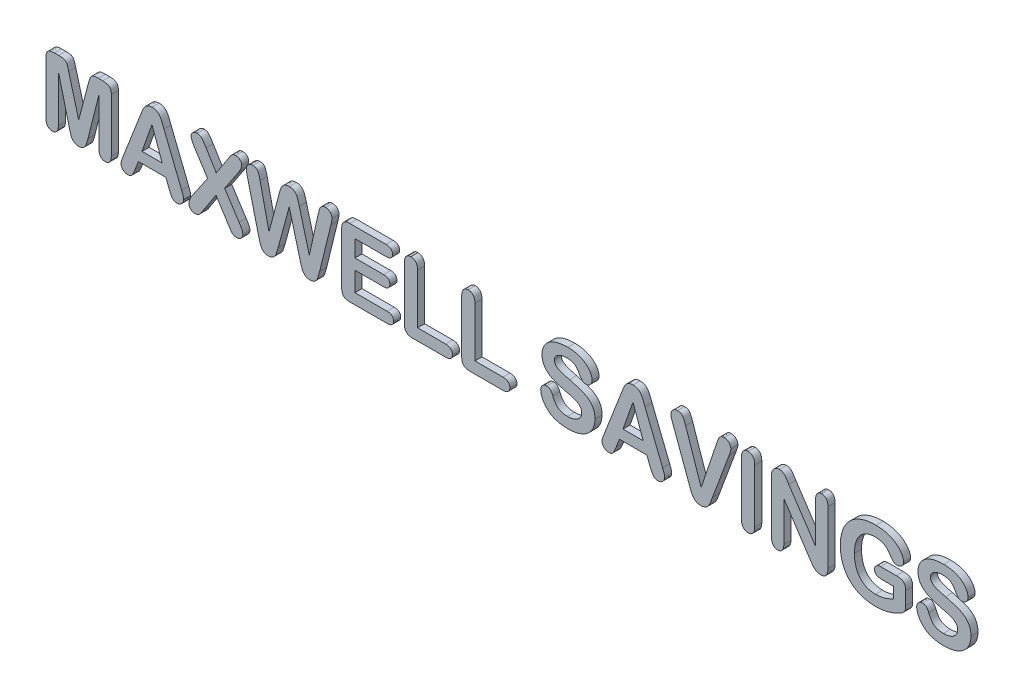
from build123d import *

# Parameters (mm, degrees)
BOSS_EXTRUDE1_DEPTH         = 0.01
BOSS_EXTRUDE1_DEPTH_BACK    = 0.99
BOSS_EXTRUDE1_2_DEPTH       = 0.01
BOSS_EXTRUDE1_2_DEPTH_BACK  = 0.99
BOSS_EXTRUDE1_3_DEPTH       = 0.01
BOSS_EXTRUDE1_3_DEPTH_BACK  = 0.99
BOSS_EXTRUDE1_4_DEPTH       = 0.01
BOSS_EXTRUDE1_4_DEPTH_BACK  = 0.99
BOSS_EXTRUDE1_5_DEPTH       = 0.01
BOSS_EXTRUDE1_5_DEPTH_BACK  = 0.99
BOSS_EXTRUDE1_6_DEPTH       = 0.01
BOSS_EXTRUDE1_6_DEPTH_BACK  = 0.99
BOSS_EXTRUDE1_7_DEPTH       = 0.01
BOSS_EXTRUDE1_7_DEPTH_BACK  = 0.99
BOSS_EXTRUDE1_8_DEPTH       = 0.01
BOSS_EXTRUDE1_8_DEPTH_BACK  = 0.99
BOSS_EXTRUDE1_9_DEPTH       = 0.01
BOSS_EXTRUDE1_9_DEPTH_BACK  = 0.99
BOSS_EXTRUDE1_10_DEPTH      = 0.01
BOSS_EXTRUDE1_10_DEPTH_BACK = 0.99
BOSS_EXTRUDE1_11_DEPTH      = 0.01
BOSS_EXTRUDE1_11_DEPTH_BACK = 0.99
BOSS_EXTRUDE1_12_DEPTH      = 0.01
BOSS_EXTRUDE1_12_DEPTH_BACK = 0.99
BOSS_EXTRUDE1_13_DEPTH      = 0.01
BOSS_EXTRUDE1_13_DEPTH_BACK = 0.99
BOSS_EXTRUDE1_14_DEPTH      = 0.01
BOSS_EXTRUDE1_14_DEPTH_BACK = 0.99


with BuildPart() as part:
    # Sketch1 → Boss-Extrude1 (new, two sides: drawn at the far end of the back side and taken through both)
    with BuildSketch(Plane.XY.offset(-BOSS_EXTRUDE1_DEPTH_BACK)):
        with BuildLine():
            Line((-62.005859375, -3.509765625), (-63.5625, 2.625))
            Line((-63.5625, 2.625), (-63.5625, -4.021484375))
            add(Edge.make_bspline(
                [(-63.5625, -4.021484375), (-63.565115673, -4.108333553), (-63.570014401, -4.27098784), (-63.615749332, -4.498257144), (-63.687034135, -4.693572789), (-63.795774215, -4.851924558), (-63.927925062, -4.974505441), (-64.080936009, -5.063874589), (-64.255240428, -5.115341408), (-64.37791392, -5.121705912), (-64.44140625, -5.125)],
                knots=[0, 0, 0, 0, 1.30362474, 2.441475632, 3.469867302, 4.406120522, 5.299256138, 6.158467928, 7.046875082, 8, 8, 8, 8], degree=3))
            add(Edge.make_bspline(
                [(-64.44140625, -5.125), (-64.502989913, -5.121744337), (-64.622542757, -5.115424092), (-64.792604586, -5.062633339), (-64.944953473, -4.97674572), (-65.0780544, -4.855798929), (-65.184417713, -4.697844546), (-65.261092587, -4.505068876), (-65.304373013, -4.277286683), (-65.30967832, -4.114123631), (-65.3125, -4.02734375)],
                knots=[0, 0, 0, 0, 0.931401934, 1.808137819, 2.66942439, 3.563139973, 4.50699297, 5.529036112, 6.685793447, 8, 8, 8, 8], degree=3))
            Line((-65.3125, -4.02734375), (-65.3125, 3.55859375))
            add(Edge.make_bspline(
                [(-65.3125, 3.55859375), (-65.311074937, 3.608744058), (-65.308330485, 3.705325833), (-65.295917096, 3.844087904), (-65.270648156, 3.970578136), (-65.233904514, 4.083104884), (-65.187953619, 4.183320343), (-65.134220222, 4.272287437), (-65.066979311, 4.34736102), (-64.96177866, 4.429365357), (-64.808198789, 4.509081757), (-64.599813443, 4.577474819), (-64.36353758, 4.618092232), (-64.196779356, 4.622624477), (-64.109375, 4.625)],
                knots=[0, 0, 0, 0, 0.969665939, 1.867427353, 2.689218696, 3.457225703, 4.149776576, 4.816702983, 5.458338976, 6.085245707, 7.385799533, 8.77853966, 10.311509556, 12, 12, 12, 12], degree=3))
            Line((-64.109375, 4.625), (-63.509765625, 4.625))
            add(Edge.make_bspline(
                [(-63.509765625, 4.625), (-63.425763329, 4.623961994), (-63.269911243, 4.62203615), (-63.0548058, 4.606316358), (-62.876893826, 4.575466592), (-62.730920948, 4.534090456), (-62.611490943, 4.472159921), (-62.510222092, 4.393777753), (-62.426778089, 4.293288687), (-62.3590496, 4.169835476), (-62.298616103, 4.01736481), (-62.235543561, 3.829676537), (-62.164438155, 3.603609013), (-62.120992289, 3.438366136), (-62.09765625, 3.349609375)],
                knots=[0, 0, 0, 0, 1.38803647, 2.575267475, 3.558583177, 4.368440808, 5.070869684, 5.768090105, 6.470518981, 7.212366556, 8.085347214, 9.177334938, 10.483864409, 12, 12, 12, 12], degree=3))
            Line((-62.09765625, 3.349609375), (-60.6875, -1.875))
            Line((-60.6875, -1.875), (-59.294921875, 3.349609375))
            add(Edge.make_bspline(
                [(-59.294921875, 3.349609375), (-59.271576903, 3.438360976), (-59.228114406, 3.603594248), (-59.157114759, 3.829722855), (-59.093735318, 4.017233875), (-59.034032703, 4.170497843), (-58.963547259, 4.292742121), (-58.880536634, 4.393861328), (-58.779089997, 4.472110301), (-58.659194642, 4.534503729), (-58.511699884, 4.57533075), (-58.331915383, 4.606332417), (-58.115497052, 4.621972956), (-57.959000135, 4.623942722), (-57.875, 4.625)],
                knots=[0, 0, 0, 0, 1.511478991, 2.813995637, 3.902629473, 4.772928891, 5.517843496, 6.218114959, 6.913193965, 7.613465427, 8.431097637, 9.421953472, 10.616226692, 12, 12, 12, 12], degree=3))
            Line((-57.875, 4.625), (-57.2734375, 4.625))
            add(Edge.make_bspline(
                [(-57.2734375, 4.625), (-57.185391515, 4.622601154), (-57.017358013, 4.618023019), (-56.779662747, 4.57777775), (-56.57080452, 4.508982102), (-56.416871711, 4.429587163), (-56.312012618, 4.346719334), (-56.24238734, 4.273095101), (-56.189706661, 4.182665075), (-56.139855299, 4.084099376), (-56.10775859, 3.969798807), (-56.078072829, 3.844477895), (-56.066958813, 3.705253376), (-56.06402394, 3.608719294), (-56.0625, 3.55859375)],
                knots=[0, 0, 0, 0, 1.69575107, 3.236297379, 4.624693315, 5.921190494, 6.546141798, 7.194208304, 7.859054455, 8.55478081, 9.316580419, 10.138397467, 11.033358612, 12, 12, 12, 12], degree=3))
            Line((-56.0625, 3.55859375), (-56.0625, -4.02734375))
            add(Edge.make_bspline(
                [(-56.0625, -4.02734375), (-56.065190179, -4.113522536), (-56.070246167, -4.275489059), (-56.115290507, -4.501716922), (-56.187666094, -4.695856015), (-56.295122683, -4.853889132), (-56.42891255, -4.975004939), (-56.582957781, -5.063908097), (-56.759188997, -5.115329058), (-56.883128372, -5.121702048), (-56.947265625, -5.125)],
                knots=[0, 0, 0, 0, 1.293518314, 2.431070022, 3.450077594, 4.386084638, 5.272371044, 6.139835868, 7.037385671, 8, 8, 8, 8], degree=3))
            add(Edge.make_bspline(
                [(-56.947265625, -5.125), (-57.008177722, -5.121700434), (-57.126414592, -5.115295626), (-57.295231157, -5.063012136), (-57.445371368, -4.973935575), (-57.577448528, -4.852028145), (-57.685571672, -4.693136327), (-57.759885775, -4.49876348), (-57.804777814, -4.270904997), (-57.809811999, -4.108304717), (-57.8125, -4.021484375)],
                knots=[0, 0, 0, 0, 0.922456205, 1.790585791, 2.649061979, 3.550299627, 4.495046019, 5.536376652, 6.684549498, 8, 8, 8, 8], degree=3))
            Line((-57.8125, -4.021484375), (-57.8125, 2.625))
            Line((-57.8125, 2.625), (-59.369140625, -3.509765625))
            add(Edge.make_bspline(
                [(-59.369140625, -3.509765625), (-59.392838979, -3.60296599), (-59.436856829, -3.776078416), (-59.503536081, -4.014819665), (-59.562726148, -4.213831958), (-59.612154146, -4.381653078), (-59.673311984, -4.525999196), (-59.751631833, -4.658383344), (-59.854349996, -4.781167705), (-59.970108261, -4.901143031), (-60.112685391, -5.003180323), (-60.282323401, -5.075451745), (-60.477017695, -5.118703871), (-60.614996455, -5.122831211), (-60.6875, -5.125)],
                knots=[0, 0, 0, 0, 1.501096557, 2.788170037, 3.868651286, 4.742863802, 5.516817816, 6.309819568, 7.133547599, 8.010237478, 8.906902995, 9.849006967, 10.869720086, 12, 12, 12, 12], degree=3))
            add(Edge.make_bspline(
                [(-60.6875, -5.125), (-60.742965136, -5.123135561), (-60.850051805, -5.119535884), (-61.003696029, -5.091688517), (-61.145006869, -5.047151561), (-61.272184027, -4.981987816), (-61.385212076, -4.902092529), (-61.4837001, -4.809836333), (-61.572892193, -4.711694149), (-61.669047233, -4.561661556), (-61.767048053, -4.355481639), (-61.853891742, -4.086511637), (-61.925546771, -3.801027381), (-61.97877998, -3.607971781), (-62.005859375, -3.509765625)],
                knots=[0, 0, 0, 0, 0.868933015, 1.67765103, 2.439282522, 3.183205666, 3.908055228, 4.601401517, 5.295498424, 5.980457608, 7.386244959, 8.861049734, 10.403235965, 12, 12, 12, 12], degree=3))
        make_face()
    extrude(amount=BOSS_EXTRUDE1_DEPTH + BOSS_EXTRUDE1_DEPTH_BACK)


with BuildPart() as body_2:
    # Sketch1 → Boss-Extrude1 2 (new, two sides: drawn at the far end of the back side and taken through both)
    with BuildSketch(Plane.XY.offset(-BOSS_EXTRUDE1_2_DEPTH_BACK)):
        with BuildLine():
            Line((-47.880859375, -3.916015625), (-48.337890625, -2.75))
            Line((-48.337890625, -2.75), (-52.2265625, -2.75))
            Line((-52.2265625, -2.75), (-52.68359375, -3.94140625))
            add(Edge.make_bspline(
                [(-52.68359375, -3.94140625), (-52.725559937, -4.048587091), (-52.802477171, -4.245032241), (-52.921695418, -4.508500222), (-53.029758103, -4.716124887), (-53.129964283, -4.877374085), (-53.246846465, -4.996260821), (-53.393408912, -5.072427525), (-53.568329803, -5.11728634), (-53.694360605, -5.122313301), (-53.76171875, -5.125)],
                knots=[0, 0, 0, 0, 1.589179946, 2.912709847, 3.990397165, 4.820646782, 5.526248733, 6.26234321, 7.071295771, 8, 8, 8, 8], degree=3))
            add(Edge.make_bspline(
                [(-53.76171875, -5.125), (-53.821353848, -5.12163933), (-53.938956889, -5.115011942), (-54.108943613, -5.06121214), (-54.267634868, -4.975415592), (-54.411600847, -4.859445914), (-54.533184576, -4.722500424), (-54.621290828, -4.570247623), (-54.677795978, -4.40884958), (-54.6842517, -4.296676202), (-54.6875, -4.240234375)],
                knots=[0, 0, 0, 0, 1.012468346, 1.996632184, 3.002236258, 4.065667855, 5.124941345, 6.097262832, 7.042607408, 8, 8, 8, 8], degree=3))
            add(Edge.make_bspline(
                [(-54.6875, -4.240234375), (-54.684489482, -4.172902148), (-54.678305318, -4.034589206), (-54.634316173, -3.860175985), (-54.581501946, -3.709382053), (-54.532703752, -3.572622181), (-54.474742579, -3.414564827), (-54.430010362, -3.303261494), (-54.40625, -3.244140625)],
                knots=[0, 0, 0, 0, 1.162779838, 2.388566498, 3.08974091, 3.926345762, 4.898539362, 6, 6, 6, 6], degree=3))
            Line((-54.40625, -3.244140625), (-51.958984375, 3.03515625))
            add(Edge.make_bspline(
                [(-51.958984375, 3.03515625), (-51.940888638, 3.082734045), (-51.903151357, 3.181953914), (-51.841144116, 3.336735313), (-51.778204347, 3.50619467), (-51.708979792, 3.684087396), (-51.638538212, 3.862254621), (-51.559227415, 4.027314829), (-51.482700498, 4.178850965), (-51.399617009, 4.313783706), (-51.309104967, 4.435620671), (-51.2053814, 4.543231239), (-51.087831167, 4.637658289), (-50.959135442, 4.723016412), (-50.814077565, 4.791486553), (-50.653024699, 4.840575417), (-50.476330978, 4.869890475), (-50.35298046, 4.873256031), (-50.2890625, 4.875)],
                knots=[0, 0, 0, 0, 0.906149852, 1.889706515, 2.96811083, 4.12389095, 5.288239382, 6.376994434, 7.382631969, 8.308939681, 9.194397083, 10.07962691, 10.961131357, 11.874074475, 12.822804478, 13.805267996, 14.862730428, 16, 16, 16, 16], degree=3))
            add(Edge.make_bspline(
                [(-50.2890625, 4.875), (-50.224485711, 4.873273754), (-50.099826039, 4.86994139), (-49.921320921, 4.840365577), (-49.759051894, 4.792502824), (-49.615275851, 4.722165399), (-49.485655381, 4.639289961), (-49.367704462, 4.546382075), (-49.265106602, 4.438994796), (-49.146254073, 4.281492623), (-49.018387982, 4.068044429), (-48.911411669, 3.837688624), (-48.833843812, 3.634953398), (-48.761291803, 3.461224707), (-48.686669379, 3.261781214), (-48.633505023, 3.121076016), (-48.60546875, 3.046875)],
                knots=[0, 0, 0, 0, 1.005463131, 1.940955953, 2.810500616, 3.631666672, 4.42517864, 5.204561669, 5.964968357, 6.731842121, 8.274852444, 9.831306624, 10.68267648, 11.656482744, 12.764143998, 14, 14, 14, 14], degree=3))
            Line((-48.60546875, 3.046875), (-46.10546875, -3.19140625))
            add(Edge.make_bspline(
                [(-46.10546875, -3.19140625), (-46.082615314, -3.24866385), (-46.038607443, -3.358922328), (-45.976365044, -3.518097034), (-45.929959175, -3.667392603), (-45.88379927, -3.801983944), (-45.854327871, -3.926696101), (-45.829863378, -4.037737732), (-45.814744026, -4.136946565), (-45.813219045, -4.199174473), (-45.8125, -4.228515625)],
                knots=[0, 0, 0, 0, 1.36622511, 2.630880465, 3.785062113, 4.829837655, 5.781525877, 6.621841003, 7.350182692, 8, 8, 8, 8], degree=3))
            add(Edge.make_bspline(
                [(-45.8125, -4.228515625), (-45.816091904, -4.283553641), (-45.823300789, -4.394013913), (-45.876114106, -4.55611351), (-45.967806096, -4.7078086), (-46.086606785, -4.850048462), (-46.229554914, -4.972020865), (-46.393152549, -5.060660635), (-46.570762281, -5.115294437), (-46.694928026, -5.121737084), (-46.7578125, -5.125)],
                knots=[0, 0, 0, 0, 0.918533131, 1.843478885, 2.81316186, 3.862812883, 4.927781559, 5.930017069, 6.951644948, 8, 8, 8, 8], degree=3))
            add(Edge.make_bspline(
                [(-46.7578125, -5.125), (-46.829243028, -5.121861359), (-46.96382278, -5.115947957), (-47.149922076, -5.055899909), (-47.302427973, -4.957789723), (-47.410231717, -4.852870913), (-47.484396631, -4.748236604), (-47.542747453, -4.652121135), (-47.603039606, -4.538500743), (-47.683329324, -4.368540183), (-47.77370205, -4.158030098), (-47.846870897, -3.992778492), (-47.880859375, -3.916015625)],
                knots=[0, 0, 0, 0, 1.202315025, 2.265239587, 3.252603888, 4.239051274, 4.781746036, 5.412840692, 6.135219166, 6.950797606, 8.583580985, 10, 10, 10, 10], degree=3))
        make_face()
        Polygon((-51.71875, -1.25), (-48.859375, -1.25), (-50.302734375, 2.75), align=None, mode=Mode.SUBTRACT)
    extrude(amount=BOSS_EXTRUDE1_2_DEPTH + BOSS_EXTRUDE1_2_DEPTH_BACK)


with BuildPart() as body_3:
    # Sketch1 → Boss-Extrude1 3 (new, two sides: drawn at the far end of the back side and taken through both)
    with BuildSketch(Plane.XY.offset(-BOSS_EXTRUDE1_3_DEPTH_BACK)):
        with BuildLine():
            Line((-44.583984375, -3.08203125), (-42.4296875, 0.072265625))
            Line((-42.4296875, 0.072265625), (-44.2421875, 2.88671875))
            add(Edge.make_bspline(
                [(-44.2421875, 2.88671875), (-44.282135352, 2.952329296), (-44.358785946, 3.078220604), (-44.464600854, 3.260367064), (-44.552599956, 3.42940374), (-44.627593576, 3.584489843), (-44.68228559, 3.733304504), (-44.724861978, 3.875678123), (-44.749117903, 4.016092182), (-44.752324369, 4.108639488), (-44.75390625, 4.154296875)],
                knots=[0, 0, 0, 0, 1.331670414, 2.555164369, 3.650619108, 4.635170215, 5.538697084, 6.395999096, 7.20868049, 8, 8, 8, 8], degree=3))
            add(Edge.make_bspline(
                [(-44.75390625, 4.154296875), (-44.750930177, 4.19964648), (-44.744945212, 4.290845772), (-44.694537689, 4.421954463), (-44.616657669, 4.545682494), (-44.508739781, 4.657092301), (-44.380811589, 4.75338965), (-44.235039639, 4.826168806), (-44.074512799, 4.867405016), (-43.963120184, 4.872433014), (-43.90625, 4.875)],
                knots=[0, 0, 0, 0, 0.88371339, 1.777171737, 2.709025234, 3.725927513, 4.789507843, 5.82502123, 6.889590265, 8, 8, 8, 8], degree=3))
            add(Edge.make_bspline(
                [(-43.90625, 4.875), (-43.842176245, 4.872101871), (-43.719461576, 4.866551348), (-43.545992105, 4.821675801), (-43.395143404, 4.743992643), (-43.262891187, 4.629335087), (-43.135605704, 4.473554956), (-42.992469952, 4.272719732), (-42.823906112, 4.022667968), (-42.708883047, 3.835766738), (-42.646484375, 3.734375)],
                knots=[0, 0, 0, 0, 0.856633498, 1.640632697, 2.377108086, 3.106645696, 3.965624018, 5.063496707, 6.406981199, 8, 8, 8, 8], degree=3))
            Line((-42.646484375, 3.734375), (-41.201171875, 1.375))
            Line((-41.201171875, 1.375), (-39.658203125, 3.734375))
            add(Edge.make_bspline(
                [(-39.658203125, 3.734375), (-39.598612497, 3.826607669), (-39.489322142, 3.995764152), (-39.342158374, 4.234074334), (-39.210557588, 4.431897443), (-39.081987256, 4.59337512), (-38.94868996, 4.722088501), (-38.795685335, 4.811329932), (-38.622858862, 4.866396622), (-38.499784371, 4.872049524), (-38.435546875, 4.875)],
                knots=[0, 0, 0, 0, 1.496623949, 2.744837013, 3.817943476, 4.732634022, 5.555221563, 6.326834216, 7.126707895, 8, 8, 8, 8], degree=3))
            add(Edge.make_bspline(
                [(-38.435546875, 4.875), (-38.37670778, 4.872567452), (-38.263327461, 4.867880041), (-38.101476087, 4.826401872), (-37.957518952, 4.754345511), (-37.834155826, 4.656166863), (-37.729889654, 4.543282227), (-37.656208525, 4.414231288), (-37.608068309, 4.275504289), (-37.603746997, 4.178130417), (-37.6015625, 4.12890625)],
                knots=[0, 0, 0, 0, 1.132100252, 2.181506828, 3.191039156, 4.209567341, 5.204189317, 6.131291943, 7.055335938, 8, 8, 8, 8], degree=3))
            add(Edge.make_bspline(
                [(-37.6015625, 4.12890625), (-37.603248628, 4.090395809), (-37.606819419, 4.008840467), (-37.631875959, 3.882596838), (-37.670958922, 3.746367655), (-37.729975357, 3.60218495), (-37.799018409, 3.445153404), (-37.888133005, 3.280776186), (-37.989962968, 3.104855672), (-38.067099755, 2.987255178), (-38.107421875, 2.92578125)],
                knots=[0, 0, 0, 0, 0.699379586, 1.481108469, 2.330742825, 3.27072707, 4.308249908, 5.445709565, 6.664782263, 8, 8, 8, 8], degree=3))
            Line((-38.107421875, 2.92578125), (-40.005859375, 0.072265625))
            Line((-40.005859375, 0.072265625), (-37.962890625, -3.08203125))
            add(Edge.make_bspline(
                [(-37.962890625, -3.08203125), (-37.91945457, -3.148140736), (-37.837205982, -3.273322729), (-37.728130228, -3.454650846), (-37.637045782, -3.617898913), (-37.56326761, -3.765248403), (-37.506592238, -3.902679776), (-37.466967666, -4.034717495), (-37.442447019, -4.16314766), (-37.439115271, -4.247949525), (-37.4375, -4.2890625)],
                knots=[0, 0, 0, 0, 1.42267206, 2.693908744, 3.805137528, 4.784457108, 5.656448903, 6.47523723, 7.260776463, 8, 8, 8, 8], degree=3))
            add(Edge.make_bspline(
                [(-37.4375, -4.2890625), (-37.439285537, -4.326892963), (-37.442787936, -4.401098871), (-37.46209672, -4.510521369), (-37.497700082, -4.614241842), (-37.546864858, -4.71169153), (-37.606957813, -4.80310823), (-37.68299658, -4.882251031), (-37.766553441, -4.95677799), (-37.864750867, -5.015653225), (-37.969911333, -5.064871634), (-38.082015932, -5.100702883), (-38.201177639, -5.119762749), (-38.282489823, -5.123223806), (-38.32421875, -5.125)],
                knots=[0, 0, 0, 0, 1.000825385, 1.963157486, 2.926720584, 3.889052685, 4.843965475, 5.806297575, 6.782844197, 7.795590722, 8.81997505, 9.848977645, 10.89610818, 12, 12, 12, 12], degree=3))
            add(Edge.make_bspline(
                [(-38.32421875, -5.125), (-38.368595652, -5.123510246), (-38.453994816, -5.120643354), (-38.576619854, -5.098442293), (-38.689771584, -5.064144415), (-38.822248032, -4.996204662), (-38.967327703, -4.888174694), (-39.085915293, -4.746053762), (-39.181380863, -4.603993721), (-39.275032174, -4.455289898), (-39.400599935, -4.269872885), (-39.489910738, -4.131074507), (-39.5390625, -4.0546875)],
                knots=[0, 0, 0, 0, 0.778086853, 1.497354761, 2.180142313, 2.844233073, 4.100730988, 5.323601136, 6.071330611, 7.104249183, 8.406337728, 10, 10, 10, 10], degree=3))
            Line((-39.5390625, -4.0546875), (-41.234375, -1.375))
            Line((-41.234375, -1.375), (-43.033203125, -4.134765625))
            add(Edge.make_bspline(
                [(-43.033203125, -4.134765625), (-43.065902083, -4.185451397), (-43.126210936, -4.278934524), (-43.206879764, -4.408500508), (-43.276232132, -4.510504058), (-43.343147488, -4.617733161), (-43.431085861, -4.730220616), (-43.541999533, -4.859876597), (-43.679976617, -4.972641967), (-43.842847229, -5.059981391), (-44.033409108, -5.117325934), (-44.170129568, -5.122351367), (-44.2421875, -5.125)],
                knots=[0, 0, 0, 0, 1.094934508, 2.019460233, 2.770064858, 3.3338705, 4.312410748, 5.358619171, 6.425449731, 7.525220658, 8.695678178, 10, 10, 10, 10], degree=3))
            add(Edge.make_bspline(
                [(-44.2421875, -5.125), (-44.299118128, -5.122629911), (-44.409367356, -5.118040106), (-44.566181392, -5.075244375), (-44.708995468, -5.008073343), (-44.834015354, -4.912152308), (-44.93859454, -4.789433276), (-45.010092279, -4.638472828), (-45.057105921, -4.465044348), (-45.060638491, -4.340840545), (-45.0625, -4.275390625)],
                knots=[0, 0, 0, 0, 1.022127674, 1.979405277, 2.901287438, 3.845220278, 4.792850708, 5.772222242, 6.8260595, 8, 8, 8, 8], degree=3))
            add(Edge.make_bspline(
                [(-45.0625, -4.275390625), (-45.060715841, -4.233651995), (-45.057015109, -4.147077068), (-45.034837002, -4.014104481), (-44.996793589, -3.874443404), (-44.94396146, -3.728098581), (-44.87465691, -3.576071401), (-44.792184084, -3.416824221), (-44.694064455, -3.251195244), (-44.621514934, -3.139705802), (-44.583984375, -3.08203125)],
                knots=[0, 0, 0, 0, 0.768817885, 1.594694242, 2.475893687, 3.431591364, 4.45659618, 5.550524954, 6.732863178, 8, 8, 8, 8], degree=3))
        make_face()
    extrude(amount=BOSS_EXTRUDE1_3_DEPTH + BOSS_EXTRUDE1_3_DEPTH_BACK)


with BuildPart() as body_4:
    # Sketch1 → Boss-Extrude1 4 (new, two sides: drawn at the far end of the back side and taken through both)
    with BuildSketch(Plane.XY.offset(-BOSS_EXTRUDE1_4_DEPTH_BACK)):
        with BuildLine():
            Line((-29.310546875, -3.43359375), (-30.865234375, 2.375))
            Line((-30.865234375, 2.375), (-32.439453125, -3.43359375))
            add(Edge.make_bspline(
                [(-32.439453125, -3.43359375), (-32.468832894, -3.535777699), (-32.523145286, -3.724678257), (-32.597102571, -3.986413126), (-32.669085691, -4.199502442), (-32.726941148, -4.376521645), (-32.793275279, -4.525734898), (-32.880478859, -4.658027264), (-32.983123703, -4.785833108), (-33.10799748, -4.902145211), (-33.252355127, -5.005413495), (-33.42437273, -5.074172528), (-33.616213264, -5.118735124), (-33.751676311, -5.122853782), (-33.822265625, -5.125)],
                knots=[0, 0, 0, 0, 1.593450199, 2.945703666, 4.074932583, 4.963578588, 5.736316224, 6.513047046, 7.331315113, 8.187222847, 9.064061049, 9.973669067, 10.944086134, 12, 12, 12, 12], degree=3))
            add(Edge.make_bspline(
                [(-33.822265625, -5.125), (-33.879655873, -5.123777239), (-33.989848911, -5.121429458), (-34.147514436, -5.095957842), (-34.289405087, -5.053064361), (-34.41645808, -4.993947143), (-34.529567313, -4.91862434), (-34.628820985, -4.827908062), (-34.718663422, -4.724767111), (-34.824230377, -4.563626392), (-34.933994966, -4.328230525), (-35.033569226, -4.018706224), (-35.112140018, -3.700389778), (-35.167087427, -3.490824318), (-35.193359375, -3.390625)],
                knots=[0, 0, 0, 0, 0.844984364, 1.622425369, 2.344584211, 3.02258317, 3.679700754, 4.338496446, 4.99812959, 5.68983231, 7.169954297, 8.807945526, 10.473786272, 12, 12, 12, 12], degree=3))
            Line((-35.193359375, -3.390625), (-36.79296875, 3.12109375))
            add(Edge.make_bspline(
                [(-36.79296875, 3.12109375), (-36.814640622, 3.20945645), (-36.855265228, 3.375095113), (-36.899425272, 3.607843511), (-36.930050555, 3.807160951), (-36.935170247, 3.928952764), (-36.9375, 3.984375)],
                knots=[0, 0, 0, 0, 1.244637899, 2.333112935, 3.241471125, 4, 4, 4, 4], degree=3))
            add(Edge.make_bspline(
                [(-36.9375, 3.984375), (-36.935120757, 4.045375129), (-36.930475848, 4.164463458), (-36.875774434, 4.332896832), (-36.795739144, 4.488436694), (-36.678349471, 4.620707587), (-36.541972665, 4.73569966), (-36.382393805, 4.815403984), (-36.208961913, 4.867406999), (-36.087628962, 4.872425655), (-36.025390625, 4.875)],
                knots=[0, 0, 0, 0, 1.026200576, 2.003414008, 2.96246285, 3.960541354, 4.968440915, 5.956723063, 6.951891004, 8, 8, 8, 8], degree=3))
            add(Edge.make_bspline(
                [(-36.025390625, 4.875), (-35.983041083, 4.873737657), (-35.901295642, 4.871301012), (-35.783756837, 4.85663138), (-35.677374577, 4.828328086), (-35.58075178, 4.793139896), (-35.49738848, 4.741692695), (-35.421891009, 4.684054029), (-35.358919018, 4.612702453), (-35.289147835, 4.498578586), (-35.213297861, 4.330775434), (-35.133380139, 4.099144154), (-35.053650744, 3.83054926), (-35.01224845, 3.636422533), (-34.990234375, 3.533203125)],
                knots=[0, 0, 0, 0, 0.808122328, 1.559882671, 2.252704358, 2.905404214, 3.512433654, 4.113718811, 4.711917797, 5.314868035, 6.65938252, 8.214937873, 9.987439056, 12, 12, 12, 12], degree=3))
            Line((-34.990234375, 3.533203125), (-33.73046875, -2.125))
            Line((-33.73046875, -2.125), (-32.3203125, 3.169921875))
            add(Edge.make_bspline(
                [(-32.3203125, 3.169921875), (-32.295299836, 3.265075478), (-32.248233736, 3.444125144), (-32.176587953, 3.693746619), (-32.10842917, 3.906821406), (-32.043573445, 4.089448942), (-31.970594005, 4.249768105), (-31.877662754, 4.393611098), (-31.76436328, 4.525129921), (-31.634409287, 4.647765724), (-31.479056364, 4.751811219), (-31.295640737, 4.822413103), (-31.088960689, 4.869588179), (-30.942352987, 4.873134541), (-30.865234375, 4.875)],
                knots=[0, 0, 0, 0, 1.431879488, 2.694354579, 3.779085509, 4.687368261, 5.51393756, 6.336587382, 7.17007913, 8.035022418, 8.931165, 9.870736774, 10.879964543, 12, 12, 12, 12], degree=3))
            add(Edge.make_bspline(
                [(-30.865234375, 4.875), (-30.787536968, 4.872129783), (-30.639815617, 4.866672813), (-30.431667037, 4.822533027), (-30.250833409, 4.745556724), (-30.100320991, 4.637728914), (-29.974491027, 4.514968243), (-29.870664898, 4.384613753), (-29.783580663, 4.251153513), (-29.720155864, 4.101980368), (-29.662601453, 3.928435763), (-29.596254624, 3.717420727), (-29.520019425, 3.45977009), (-29.468984097, 3.271601902), (-29.44140625, 3.169921875)],
                knots=[0, 0, 0, 0, 1.14054899, 2.168456379, 3.106445743, 4.005812281, 4.871449232, 5.680910185, 6.450289684, 7.203755686, 8.053559891, 9.136318933, 10.452559013, 12, 12, 12, 12], degree=3))
            Line((-29.44140625, 3.169921875), (-28.01953125, -2.125))
            Line((-28.01953125, -2.125), (-26.759765625, 3.533203125))
            add(Edge.make_bspline(
                [(-26.759765625, 3.533203125), (-26.745203519, 3.602956132), (-26.717635984, 3.735005604), (-26.672380352, 3.920388762), (-26.629661041, 4.081938435), (-26.589091882, 4.22394348), (-26.539779701, 4.350353871), (-26.476440392, 4.467320589), (-26.39771365, 4.576283124), (-26.306236255, 4.679528695), (-26.194833556, 4.770339035), (-26.056264075, 4.832071548), (-25.897191011, 4.869751076), (-25.784087119, 4.873191035), (-25.724609375, 4.875)],
                knots=[0, 0, 0, 0, 1.365133971, 2.584336173, 3.655375053, 4.566954256, 5.412386126, 6.249588628, 7.10798716, 7.982279155, 8.888122676, 9.836835566, 10.862460541, 12, 12, 12, 12], degree=3))
            add(Edge.make_bspline(
                [(-25.724609375, 4.875), (-25.663098221, 4.872186562), (-25.543371048, 4.866710401), (-25.370896544, 4.81816627), (-25.214071397, 4.736139207), (-25.074879007, 4.625021017), (-24.956647674, 4.492247993), (-24.873385, 4.336858845), (-24.819725529, 4.166274079), (-24.814947384, 4.045986671), (-24.8125, 3.984375)],
                knots=[0, 0, 0, 0, 1.03699291, 2.018434435, 2.996793341, 4.006213175, 5.011314616, 5.975429195, 6.96300709, 8, 8, 8, 8], degree=3))
            add(Edge.make_bspline(
                [(-24.8125, 3.984375), (-24.815130941, 3.932893404), (-24.821113504, 3.815828105), (-24.847516271, 3.619824633), (-24.89681515, 3.384122829), (-24.935883951, 3.21346696), (-24.95703125, 3.12109375)],
                knots=[0, 0, 0, 0, 0.70532364, 1.603853198, 2.703005224, 4, 4, 4, 4], degree=3))
            Line((-24.95703125, 3.12109375), (-26.556640625, -3.390625))
            add(Edge.make_bspline(
                [(-26.556640625, -3.390625), (-26.582234585, -3.492956944), (-26.629941291, -3.683701943), (-26.702730154, -3.947085852), (-26.76591849, -4.167793497), (-26.825453516, -4.350422387), (-26.888740077, -4.507766878), (-26.972875868, -4.64757513), (-27.074253629, -4.778996997), (-27.195842111, -4.898577986), (-27.338077838, -5.004154831), (-27.512969592, -5.072862769), (-27.711079768, -5.119489074), (-27.853204209, -5.123104216), (-27.927734375, -5.125)],
                knots=[0, 0, 0, 0, 1.552883699, 2.894548732, 4.02287014, 4.932163049, 5.722544985, 6.513217449, 7.326118303, 8.159774563, 9.018830479, 9.912428932, 10.905276121, 12, 12, 12, 12], degree=3))
            add(Edge.make_bspline(
                [(-27.927734375, -5.125), (-27.998305598, -5.122828064), (-28.133733929, -5.118660051), (-28.325813745, -5.074437631), (-28.497163983, -5.004434176), (-28.64380058, -4.905700177), (-28.765949377, -4.788988912), (-28.870736512, -4.66558672), (-28.955923215, -4.534690718), (-29.021092993, -4.38737367), (-29.079874058, -4.213031426), (-29.148683256, -3.99761658), (-29.22551489, -3.732026798), (-29.280675675, -3.538431397), (-29.310546875, -3.43359375)],
                knots=[0, 0, 0, 0, 1.054963199, 2.024506573, 2.933295648, 3.811943645, 4.653302703, 5.455819296, 6.231850806, 6.982109028, 7.860757024, 8.985975481, 10.367816402, 12, 12, 12, 12], degree=3))
        make_face()
    extrude(amount=BOSS_EXTRUDE1_4_DEPTH + BOSS_EXTRUDE1_4_DEPTH_BACK)


with BuildPart() as body_5:
    # Sketch1 → Boss-Extrude1 5 (new, two sides: drawn at the far end of the back side and taken through both)
    with BuildSketch(Plane.XY.offset(-BOSS_EXTRUDE1_5_DEPTH_BACK)):
        with BuildLine():
            Line((-17.15234375, 3.125), (-21.5625, 3.125))
            Line((-21.5625, 3.125), (-21.5625, 0.75))
            Line((-21.5625, 0.75), (-17.501953125, 0.75))
            add(Edge.make_bspline(
                [(-17.501953125, 0.75), (-17.431489646, 0.747333258), (-17.299225608, 0.742327628), (-17.114081011, 0.706920814), (-16.95750033, 0.641933335), (-16.830115384, 0.551245478), (-16.732283169, 0.438451614), (-16.660366833, 0.309866938), (-16.61832313, 0.162706707), (-16.613721224, 0.059519254), (-16.611328125, 0.005859375)],
                knots=[0, 0, 0, 0, 1.285293232, 2.412569968, 3.418386025, 4.354403319, 5.23810445, 6.120527863, 7.022630715, 8, 8, 8, 8], degree=3))
            add(Edge.make_bspline(
                [(-16.611328125, 0.005859375), (-16.61365399, -0.047833383), (-16.618126607, -0.151084063), (-16.661150739, -0.298055229), (-16.730412354, -0.429341615), (-16.827308322, -0.544507816), (-16.953638531, -0.638539931), (-17.11061618, -0.705147523), (-17.297064881, -0.742847832), (-17.430808324, -0.747516502), (-17.501953125, -0.75)],
                knots=[0, 0, 0, 0, 0.971200242, 1.867609123, 2.749214551, 3.645234956, 4.57279535, 5.576919765, 6.711042891, 8, 8, 8, 8], degree=3))
            Line((-17.501953125, -0.75), (-21.5625, -0.75))
            Line((-21.5625, -0.75), (-21.5625, -3.5))
            Line((-21.5625, -3.5), (-17, -3.5))
            add(Edge.make_bspline(
                [(-17, -3.5), (-16.92759868, -3.502709108), (-16.791491941, -3.50780194), (-16.599648356, -3.542970582), (-16.437073491, -3.609775375), (-16.302825839, -3.701230656), (-16.19673426, -3.813480509), (-16.123760047, -3.946957235), (-16.07635845, -4.095785245), (-16.072367683, -4.201445823), (-16.0703125, -4.255859375)],
                knots=[0, 0, 0, 0, 1.281412047, 2.408917619, 3.431661904, 4.368016538, 5.264760761, 6.136510243, 7.040331808, 8, 8, 8, 8], degree=3))
            add(Edge.make_bspline(
                [(-16.0703125, -4.255859375), (-16.072260443, -4.309012912), (-16.07601934, -4.41158199), (-16.124615387, -4.556134534), (-16.197261771, -4.686864638), (-16.302847164, -4.798628403), (-16.43662133, -4.890779767), (-16.6004058, -4.953903039), (-16.791130116, -4.99313345), (-16.927518087, -4.997617174), (-17, -5)],
                knots=[0, 0, 0, 0, 0.944744106, 1.823049547, 2.692159438, 3.596595969, 4.540982691, 5.5681055, 6.707595947, 8, 8, 8, 8], degree=3))
            Line((-17, -5), (-22.2890625, -5))
            add(Edge.make_bspline(
                [(-22.2890625, -5), (-22.384406203, -4.997225367), (-22.561830366, -4.99206208), (-22.807650572, -4.939612428), (-23.01254655, -4.852858758), (-23.178157975, -4.72523122), (-23.297884708, -4.551923754), (-23.381473846, -4.339708465), (-23.428091596, -4.085313662), (-23.434219406, -3.902538377), (-23.4375, -3.8046875)],
                knots=[0, 0, 0, 0, 1.189456171, 2.21344733, 3.119993849, 3.948013107, 4.78741338, 5.71757596, 6.778077714, 8, 8, 8, 8], degree=3))
            Line((-23.4375, -3.8046875), (-23.4375, 3.4296875))
            add(Edge.make_bspline(
                [(-23.4375, 3.4296875), (-23.435998423, 3.496806697), (-23.433147095, 3.624258547), (-23.411939858, 3.806193027), (-23.375856257, 3.969078186), (-23.322771563, 4.113665424), (-23.254999322, 4.240931987), (-23.167108152, 4.348642351), (-23.062067591, 4.437176397), (-22.940752545, 4.509006552), (-22.801398028, 4.560364861), (-22.646506667, 4.600322678), (-22.473166838, 4.620264276), (-22.352252588, 4.623374559), (-22.2890625, 4.625)],
                knots=[0, 0, 0, 0, 1.257097402, 2.387087425, 3.425508426, 4.374733264, 5.264346199, 6.113849079, 6.961774747, 7.825601221, 8.740599092, 9.73444991, 10.816017894, 12, 12, 12, 12], degree=3))
            Line((-22.2890625, 4.625), (-17.15234375, 4.625))
            add(Edge.make_bspline(
                [(-17.15234375, 4.625), (-17.079316085, 4.622233404), (-16.941964858, 4.617029959), (-16.749114638, 4.58274782), (-16.587588372, 4.515009978), (-16.454646522, 4.424533036), (-16.354664613, 4.310656117), (-16.278712703, 4.182270802), (-16.23554425, 4.03524345), (-16.230898565, 3.931909817), (-16.228515625, 3.87890625)],
                knots=[0, 0, 0, 0, 1.304353081, 2.453241492, 3.474309848, 4.409392115, 5.298405909, 6.157667996, 7.055001114, 8, 8, 8, 8], degree=3))
            add(Edge.make_bspline(
                [(-16.228515625, 3.87890625), (-16.230805498, 3.824572797), (-16.235244088, 3.719255189), (-16.279297639, 3.56949827), (-16.353371483, 3.43790689), (-16.45485263, 3.323737681), (-16.587103377, 3.232591285), (-16.749657504, 3.167895788), (-16.941874716, 3.132760899), (-17.079284795, 3.127693998), (-17.15234375, 3.125)],
                knots=[0, 0, 0, 0, 0.962139494, 1.864969442, 2.738963821, 3.622448103, 4.551714319, 5.562017248, 6.70375977, 8, 8, 8, 8], degree=3))
        make_face()
    extrude(amount=BOSS_EXTRUDE1_5_DEPTH + BOSS_EXTRUDE1_5_DEPTH_BACK)


with BuildPart() as body_6:
    # Sketch1 → Boss-Extrude1 6 (new, two sides: drawn at the far end of the back side and taken through both)
    with BuildSketch(Plane.XY.offset(-BOSS_EXTRUDE1_6_DEPTH_BACK)):
        with BuildLine():
            Line((-12.6875, 3.68359375), (-12.6875, -3.375))
            Line((-12.6875, -3.375), (-8.71875, -3.375))
            add(Edge.make_bspline(
                [(-8.71875, -3.375), (-8.644242046, -3.376950533), (-8.502159963, -3.38067008), (-8.303515026, -3.426650216), (-8.129487189, -3.497793566), (-7.988779816, -3.603589625), (-7.875365625, -3.727332721), (-7.792995467, -3.868867939), (-7.744815787, -4.026888166), (-7.739199524, -4.137041713), (-7.736328125, -4.193359375)],
                knots=[0, 0, 0, 0, 1.240270116, 2.365118784, 3.381765818, 4.352609133, 5.275186246, 6.165500839, 7.062084633, 8, 8, 8, 8], degree=3))
            add(Edge.make_bspline(
                [(-7.736328125, -4.193359375), (-7.739082638, -4.250996325), (-7.744410932, -4.362488487), (-7.793053064, -4.521724114), (-7.874446148, -4.662198011), (-7.986422715, -4.783324494), (-8.12695452, -4.883442834), (-8.300187849, -4.949920691), (-8.499729245, -4.99420659), (-8.642950836, -4.997995004), (-8.71875, -5)],
                knots=[0, 0, 0, 0, 0.961785517, 1.860465312, 2.752861249, 3.654173772, 4.599371787, 5.609990076, 6.735101654, 8, 8, 8, 8], degree=3))
            Line((-8.71875, -5), (-13.4140625, -5))
            add(Edge.make_bspline(
                [(-13.4140625, -5), (-13.509477926, -4.997503521), (-13.687177879, -4.992854125), (-13.932270974, -4.936989687), (-14.13832401, -4.851334169), (-14.302503362, -4.721146269), (-14.423510287, -4.547733203), (-14.506313475, -4.333683265), (-14.553122974, -4.077519434), (-14.559231215, -3.893433983), (-14.5625, -3.794921875)],
                knots=[0, 0, 0, 0, 1.184943227, 2.206816713, 3.109923682, 3.939837529, 4.776053014, 5.71019795, 6.774627611, 8, 8, 8, 8], degree=3))
            Line((-14.5625, -3.794921875), (-14.5625, 3.68359375))
            add(Edge.make_bspline(
                [(-14.5625, 3.68359375), (-14.560084136, 3.776936893), (-14.555534581, 3.952720682), (-14.507075526, 4.197686649), (-14.427290872, 4.406509849), (-14.314952607, 4.578449951), (-14.173810369, 4.711021337), (-14.012326076, 4.807968728), (-13.829062562, 4.863785104), (-13.700895995, 4.871182929), (-13.634765625, 4.875)],
                knots=[0, 0, 0, 0, 1.312227502, 2.471186598, 3.495416453, 4.440711492, 5.33513045, 6.197779038, 7.0701043, 8, 8, 8, 8], degree=3))
            add(Edge.make_bspline(
                [(-13.634765625, 4.875), (-13.567228286, 4.872269864), (-13.436057096, 4.866967388), (-13.250592987, 4.806913881), (-13.084249754, 4.71426231), (-12.941388815, 4.58187524), (-12.823370214, 4.412530409), (-12.743112074, 4.202313804), (-12.694208899, 3.955377503), (-12.689836736, 3.778257124), (-12.6875, 3.68359375)],
                knots=[0, 0, 0, 0, 0.937651975, 1.821110013, 2.686129292, 3.571911612, 4.510265029, 5.535848738, 6.683015045, 8, 8, 8, 8], degree=3))
        make_face()
    extrude(amount=BOSS_EXTRUDE1_6_DEPTH + BOSS_EXTRUDE1_6_DEPTH_BACK)


with BuildPart() as body_7:
    # Sketch1 → Boss-Extrude1 7 (new, two sides: drawn at the far end of the back side and taken through both)
    with BuildSketch(Plane.XY.offset(-BOSS_EXTRUDE1_7_DEPTH_BACK)):
        with BuildLine():
            Line((-4.5625, 3.68359375), (-4.5625, -3.375))
            Line((-4.5625, -3.375), (-0.59375, -3.375))
            add(Edge.make_bspline(
                [(-0.59375, -3.375), (-0.519242046, -3.376950533), (-0.377159963, -3.38067008), (-0.178515026, -3.426650216), (-0.004487189, -3.497793566), (0.136220184, -3.603589625), (0.249634375, -3.727332721), (0.332004533, -3.868867939), (0.380184213, -4.026888166), (0.385800476, -4.137041713), (0.388671875, -4.193359375)],
                knots=[0, 0, 0, 0, 1.240270116, 2.365118784, 3.381765818, 4.352609133, 5.275186246, 6.165500839, 7.062084633, 8, 8, 8, 8], degree=3))
            add(Edge.make_bspline(
                [(0.388671875, -4.193359375), (0.385917362, -4.250996325), (0.380589068, -4.362488487), (0.331946936, -4.521724114), (0.250553852, -4.662198011), (0.138577285, -4.783324494), (-0.00195452, -4.883442834), (-0.175187849, -4.949920691), (-0.374729245, -4.99420659), (-0.517950836, -4.997995004), (-0.59375, -5)],
                knots=[0, 0, 0, 0, 0.961785517, 1.860465312, 2.752861249, 3.654173772, 4.599371787, 5.609990076, 6.735101654, 8, 8, 8, 8], degree=3))
            Line((-0.59375, -5), (-5.2890625, -5))
            add(Edge.make_bspline(
                [(-5.2890625, -5), (-5.384477926, -4.997503521), (-5.562177879, -4.992854125), (-5.807270974, -4.936989687), (-6.01332401, -4.851334169), (-6.177503362, -4.721146269), (-6.298510287, -4.547733203), (-6.381313475, -4.333683265), (-6.428122974, -4.077519434), (-6.434231215, -3.893433983), (-6.4375, -3.794921875)],
                knots=[0, 0, 0, 0, 1.184943227, 2.206816713, 3.109923682, 3.939837529, 4.776053014, 5.71019795, 6.774627611, 8, 8, 8, 8], degree=3))
            Line((-6.4375, -3.794921875), (-6.4375, 3.68359375))
            add(Edge.make_bspline(
                [(-6.4375, 3.68359375), (-6.435084136, 3.776936893), (-6.430534581, 3.952720682), (-6.382075526, 4.197686649), (-6.302290872, 4.406509849), (-6.189952607, 4.578449951), (-6.048810369, 4.711021337), (-5.887326076, 4.807968728), (-5.704062562, 4.863785104), (-5.575895995, 4.871182929), (-5.509765625, 4.875)],
                knots=[0, 0, 0, 0, 1.312227502, 2.471186598, 3.495416453, 4.440711492, 5.33513045, 6.197779038, 7.0701043, 8, 8, 8, 8], degree=3))
            add(Edge.make_bspline(
                [(-5.509765625, 4.875), (-5.442228286, 4.872269864), (-5.311057096, 4.866967388), (-5.125592987, 4.806913881), (-4.959249754, 4.71426231), (-4.816388815, 4.58187524), (-4.698370214, 4.412530409), (-4.618112074, 4.202313804), (-4.569208899, 3.955377503), (-4.564836736, 3.778257124), (-4.5625, 3.68359375)],
                knots=[0, 0, 0, 0, 0.937651975, 1.821110013, 2.686129292, 3.571911612, 4.510265029, 5.535848738, 6.683015045, 8, 8, 8, 8], degree=3))
        make_face()
    extrude(amount=BOSS_EXTRUDE1_7_DEPTH + BOSS_EXTRUDE1_7_DEPTH_BACK)


with BuildPart() as body_8:
    # Sketch1 → Boss-Extrude1 8 (new, two sides: drawn at the far end of the back side and taken through both)
    with BuildSketch(Plane.XY.offset(-BOSS_EXTRUDE1_8_DEPTH_BACK)):
        with BuildLine():
            add(Edge.make_bspline(
                [(12.4375, -2.005859375), (12.435891198, -2.079479307), (12.43270948, -2.225077014), (12.410637477, -2.440410778), (12.375540352, -2.64985281), (12.327200545, -2.85387428), (12.262162019, -3.051409258), (12.183272859, -3.243630024), (12.092677358, -3.43145255), (11.983703831, -3.611205384), (11.864199142, -3.784415205), (11.729526177, -3.947612824), (11.583972279, -4.102412879), (11.421859631, -4.245094743), (11.248491451, -4.379691909), (11.062090158, -4.505350028), (10.862242784, -4.62050622), (10.64973311, -4.725876113), (10.425098099, -4.819275189), (10.190222572, -4.900931007), (9.945698821, -4.972981034), (9.689679295, -5.024833129), (9.42499029, -5.071923322), (9.148958781, -5.101540545), (8.862951147, -5.122312251), (8.668659676, -5.124096727), (8.5703125, -5.125)],
                knots=[0, 0, 0, 0, 0.94904565, 1.876922008, 2.787632434, 3.685409961, 4.577243309, 5.465673456, 6.362823001, 7.262481841, 8.172882791, 9.073480814, 9.987781212, 10.909257821, 11.854472834, 12.815908446, 13.804938933, 14.825933836, 15.871877953, 16.938992789, 18.030809531, 19.155177508, 20.304610591, 21.495671913, 22.732349945, 24, 24, 24, 24], degree=3))
            add(Edge.make_bspline(
                [(8.5703125, -5.125), (8.453092633, -5.122792186), (8.222937379, -5.118457256), (7.885527873, -5.094304385), (7.564330398, -5.048153478), (7.257863617, -4.988871195), (6.967285077, -4.909119941), (6.693172368, -4.810299519), (6.432729584, -4.699016671), (6.271327614, -4.606405246), (6.19140625, -4.560546875)],
                knots=[0, 0, 0, 0, 1.136969792, 2.232382444, 3.278022597, 4.282276305, 5.258039159, 6.196692155, 7.1070566, 8, 8, 8, 8], degree=3))
            add(Edge.make_bspline(
                [(6.19140625, -4.560546875), (6.087826217, -4.492233777), (5.881731252, -4.356310036), (5.608285246, -4.104979022), (5.359449365, -3.827473301), (5.148375641, -3.519863748), (4.975487222, -3.199706536), (4.848262648, -2.87763328), (4.769908805, -2.558415676), (4.759164986, -2.346105931), (4.75390625, -2.2421875)],
                knots=[0, 0, 0, 0, 1.048405233, 2.086029851, 3.131870059, 4.19698972, 5.234628962, 6.204463721, 7.121145791, 8, 8, 8, 8], degree=3))
            add(Edge.make_bspline(
                [(4.75390625, -2.2421875), (4.756876094, -2.18393984), (4.762676386, -2.070178519), (4.809227359, -1.906783062), (4.885430958, -1.757472797), (4.987944935, -1.622848136), (5.116410322, -1.511777844), (5.263958257, -1.430149823), (5.428282167, -1.378593207), (5.543880521, -1.37364595), (5.603515625, -1.37109375)],
                knots=[0, 0, 0, 0, 1.029346977, 2.010378973, 2.978887221, 3.98112847, 4.985683985, 5.960201932, 6.947705008, 8, 8, 8, 8], degree=3))
            add(Edge.make_bspline(
                [(5.603515625, -1.37109375), (5.651969645, -1.372975474), (5.745874941, -1.376622309), (5.880682137, -1.415911419), (6.003321765, -1.479069648), (6.114296489, -1.568100087), (6.216659373, -1.6784279), (6.308165816, -1.814517622), (6.394703892, -1.972189821), (6.440774246, -2.089238449), (6.46484375, -2.150390625)],
                knots=[0, 0, 0, 0, 0.932433643, 1.807083439, 2.683354794, 3.577798377, 4.537574086, 5.575745438, 6.73344572, 8, 8, 8, 8], degree=3))
            add(Edge.make_bspline(
                [(6.46484375, -2.150390625), (6.496837073, -2.224200351), (6.558588515, -2.366663106), (6.657244303, -2.569437779), (6.764288372, -2.750455528), (6.870559256, -2.91857138), (6.994048269, -3.069313793), (7.140836749, -3.201924095), (7.30787841, -3.323969914), (7.498766802, -3.432434184), (7.717124531, -3.522028061), (7.967728811, -3.579500625), (8.246704072, -3.6204188), (8.443837284, -3.623427441), (8.546875, -3.625)],
                knots=[0, 0, 0, 0, 1.049400523, 2.025484958, 2.938775158, 3.791458515, 4.617854192, 5.471340711, 6.364831691, 7.311813007, 8.329001391, 9.430967745, 10.65721654, 12, 12, 12, 12], degree=3))
            add(Edge.make_bspline(
                [(8.546875, -3.625), (8.6198459, -3.624118859), (8.762808756, -3.62239255), (8.971456982, -3.601767397), (9.170211337, -3.571778176), (9.356939224, -3.525629172), (9.535191978, -3.472594386), (9.700942255, -3.400861302), (9.857611587, -3.319561258), (10.002023789, -3.225836949), (10.132817381, -3.122540506), (10.248338112, -3.012175858), (10.345186377, -2.893894497), (10.423520615, -2.769520441), (10.487866269, -2.640681012), (10.529505998, -2.503874159), (10.559421425, -2.361978505), (10.561461266, -2.264488079), (10.5625, -2.21484375)],
                knots=[0, 0, 0, 0, 1.280104897, 2.507951138, 3.676307556, 4.80418709, 5.881088807, 6.935759984, 7.968101261, 8.975871649, 9.951925376, 10.889226907, 11.77430911, 12.626938706, 13.464975202, 14.292430499, 15.130466995, 16, 16, 16, 16], degree=3))
            add(Edge.make_bspline(
                [(10.5625, -2.21484375), (10.558953934, -2.13827413), (10.552118346, -1.990674434), (10.493798628, -1.781315854), (10.398693287, -1.594049697), (10.262012032, -1.433873022), (10.098217026, -1.2936663), (9.911971886, -1.170060986), (9.702442181, -1.067046081), (9.469046593, -0.978392873), (9.203969957, -0.900049622), (8.903818864, -0.814716407), (8.561719624, -0.732754419), (8.320359805, -0.677507643), (8.193359375, -0.6484375)],
                knots=[0, 0, 0, 0, 0.889216893, 1.714102054, 2.506617733, 3.313297162, 4.145346194, 5.008548814, 5.905982136, 6.85524107, 7.90915739, 9.119934543, 10.484546625, 12, 12, 12, 12], degree=3))
            add(Edge.make_bspline(
                [(8.193359375, -0.6484375), (8.026962777, -0.607566926), (7.706731214, -0.528911184), (7.251007891, -0.392287096), (6.83777596, -0.245589961), (6.462237314, -0.09153083), (6.126315025, 0.086572051), (5.827103709, 0.292772225), (5.566697598, 0.530681906), (5.377256067, 0.751529997), (5.249982261, 0.944345249), (5.164915377, 1.097160302), (5.094923937, 1.259609956), (5.038524471, 1.430431863), (4.993655234, 1.608659802), (4.960067155, 1.795176506), (4.940348877, 1.99045454), (4.938460533, 2.123652949), (4.9375, 2.19140625)],
                knots=[0, 0, 0, 0, 1.736501148, 3.341910126, 4.819600125, 6.179978285, 7.452384316, 8.666026066, 9.852526874, 11.018500134, 11.604160195, 12.191898388, 12.788898658, 13.394048862, 14.013423104, 14.650267458, 15.313438986, 16, 16, 16, 16], degree=3))
            add(Edge.make_bspline(
                [(4.9375, 2.19140625), (4.938197468, 2.256591758), (4.939575511, 2.385383864), (4.963511137, 2.575639907), (4.994284785, 2.761124033), (5.045349089, 2.939881902), (5.104965295, 3.114035952), (5.179153686, 3.283157577), (5.270150644, 3.444557001), (5.370933413, 3.601736816), (5.48700276, 3.749807716), (5.61425641, 3.891456927), (5.75478263, 4.023966682), (5.907464662, 4.14657752), (6.07051689, 4.261328259), (6.247480288, 4.364601648), (6.436499792, 4.459282976), (6.706193352, 4.579382972), (7.071870874, 4.698885125), (7.541443043, 4.802713879), (8.04794177, 4.862540655), (8.397629013, 4.870758331), (8.578125, 4.875)],
                knots=[0, 0, 0, 0, 0.769447055, 1.520256708, 2.262508943, 2.988321943, 3.713156319, 4.436274914, 5.166110871, 5.89994773, 6.639925254, 7.385953261, 8.147635144, 8.918771606, 9.697541001, 10.500837489, 11.336648996, 12.194084557, 13.986552036, 15.869357873, 17.867910982, 20, 20, 20, 20], degree=3))
            add(Edge.make_bspline(
                [(8.578125, 4.875), (8.722111613, 4.872584226), (9.000292127, 4.867916978), (9.402551367, 4.826313578), (9.774594337, 4.759397374), (10.116513417, 4.663833186), (10.427518723, 4.54220085), (10.71516168, 4.410389001), (10.971365294, 4.252324496), (11.200515552, 4.080561122), (11.400719372, 3.898083171), (11.572611832, 3.708993205), (11.716551673, 3.515953186), (11.829500897, 3.317503283), (11.918417248, 3.120039308), (11.981413133, 2.923584633), (12.020766162, 2.728796114), (12.025170575, 2.599133098), (12.02734375, 2.53515625)],
                knots=[0, 0, 0, 0, 1.501690988, 2.90125006, 4.213360721, 5.441058994, 6.597662568, 7.694391675, 8.736870916, 9.731158549, 10.678212085, 11.558107852, 12.393499291, 13.184506524, 13.935459515, 14.648542639, 15.3331793, 16, 16, 16, 16], degree=3))
            add(Edge.make_bspline(
                [(12.02734375, 2.53515625), (12.024291243, 2.478213897), (12.018263182, 2.36576469), (11.971217895, 2.201791962), (11.893586054, 2.048140769), (11.789083814, 1.907024007), (11.662884146, 1.786074948), (11.516203912, 1.69782278), (11.354173949, 1.642024143), (11.240037915, 1.635930361), (11.181640625, 1.6328125)],
                knots=[0, 0, 0, 0, 0.996822281, 1.968514991, 2.963507279, 3.999520829, 5.032703306, 6.005199511, 6.979367534, 8, 8, 8, 8], degree=3))
            add(Edge.make_bspline(
                [(11.181640625, 1.6328125), (11.13006533, 1.634590336), (11.032617158, 1.63794944), (10.896089982, 1.665252438), (10.778135608, 1.709417319), (10.677238014, 1.775891368), (10.587797994, 1.864357271), (10.498984582, 1.973561709), (10.402157403, 2.10177162), (10.342276524, 2.198660546), (10.310546875, 2.25)],
                knots=[0, 0, 0, 0, 1.091449335, 2.062222683, 2.935356023, 3.742291246, 4.60049062, 5.589116983, 6.722522559, 8, 8, 8, 8], degree=3))
            add(Edge.make_bspline(
                [(10.310546875, 2.25), (10.264776899, 2.344030145), (10.17645936, 2.525470287), (10.019721191, 2.773849828), (9.84651012, 2.987331037), (9.691547676, 3.144249744), (9.554877528, 3.25224317), (9.435619657, 3.318144324), (9.303038663, 3.373823481), (9.157033062, 3.421811), (8.995818993, 3.455781704), (8.82029476, 3.480773634), (8.63048704, 3.496490421), (8.499379836, 3.498804424), (8.431640625, 3.5)],
                knots=[0, 0, 0, 0, 1.547925219, 2.986869477, 4.337480217, 5.612327564, 6.244828973, 6.909713596, 7.622436063, 8.372459485, 9.181850378, 10.058552105, 10.996911345, 12, 12, 12, 12], degree=3))
            add(Edge.make_bspline(
                [(8.431640625, 3.5), (8.307060571, 3.495869193), (8.069315041, 3.487986063), (7.730171107, 3.428878846), (7.429628891, 3.322753581), (7.209038067, 3.200317665), (7.055106748, 3.087823845), (6.958088294, 2.997624653), (6.873666244, 2.905550043), (6.807323204, 2.806812128), (6.754198879, 2.704648837), (6.713376511, 2.598330835), (6.692724539, 2.486475138), (6.689242373, 2.410874963), (6.6875, 2.373046875)],
                knots=[0, 0, 0, 0, 1.954508865, 3.729936959, 5.377867423, 6.932763574, 7.670377485, 8.364471239, 9.008409927, 9.626125187, 10.224705099, 10.812996495, 11.406058616, 12, 12, 12, 12], degree=3))
            add(Edge.make_bspline(
                [(6.6875, 2.373046875), (6.689156268, 2.326640368), (6.692415473, 2.235321655), (6.724586002, 2.103893624), (6.776538816, 1.982140983), (6.847424742, 1.869756299), (6.938263023, 1.768124674), (7.046284441, 1.677025891), (7.16426375, 1.587409797), (7.34586252, 1.486019081), (7.582500499, 1.375226132), (7.836006158, 1.287267192), (8.064752929, 1.225875511), (8.283230476, 1.170036298), (8.548265345, 1.100617678), (8.741438871, 1.054297769), (8.845703125, 1.029296875)],
                knots=[0, 0, 0, 0, 0.710476229, 1.398074961, 2.059979244, 2.732930957, 3.425942516, 4.140543967, 4.897202213, 5.693324271, 7.323324828, 8.898613798, 9.799484583, 10.954336094, 12.356121149, 14, 14, 14, 14], degree=3))
            add(Edge.make_bspline(
                [(8.845703125, 1.029296875), (8.978661974, 0.997327844), (9.238762265, 0.934788537), (9.618568131, 0.833035), (9.979060147, 0.726553531), (10.319856058, 0.612913701), (10.639647114, 0.494645556), (10.934189698, 0.360677356), (11.204749808, 0.216992177), (11.45138682, 0.058902041), (11.671902577, -0.118543895), (11.870067967, -0.313899928), (12.038262944, -0.535198192), (12.182094768, -0.777154238), (12.299872471, -1.043731214), (12.380443702, -1.339833694), (12.429829622, -1.663695612), (12.434883355, -1.889134855), (12.4375, -2.005859375)],
                knots=[0, 0, 0, 0, 1.267502217, 2.479546844, 3.644246111, 4.751070339, 5.809111578, 6.802976886, 7.747931384, 8.64678748, 9.513844361, 10.367269951, 11.219414442, 12.082556445, 12.971635876, 13.911644553, 14.918722911, 16, 16, 16, 16], degree=3))
        make_face()
    extrude(amount=BOSS_EXTRUDE1_8_DEPTH + BOSS_EXTRUDE1_8_DEPTH_BACK)


with BuildPart() as body_9:
    # Sketch1 → Boss-Extrude1 9 (new, two sides: drawn at the far end of the back side and taken through both)
    with BuildSketch(Plane.XY.offset(-BOSS_EXTRUDE1_9_DEPTH_BACK)):
        with BuildLine():
            Line((20.244140625, -3.916015625), (19.787109375, -2.75))
            Line((19.787109375, -2.75), (15.8984375, -2.75))
            Line((15.8984375, -2.75), (15.44140625, -3.94140625))
            add(Edge.make_bspline(
                [(15.44140625, -3.94140625), (15.399440063, -4.048587091), (15.322522829, -4.245032241), (15.203304582, -4.508500222), (15.095241897, -4.716124887), (14.995035717, -4.877374085), (14.878153535, -4.996260821), (14.731591088, -5.072427525), (14.556670197, -5.11728634), (14.430639395, -5.122313301), (14.36328125, -5.125)],
                knots=[0, 0, 0, 0, 1.589179946, 2.912709847, 3.990397165, 4.820646782, 5.526248733, 6.26234321, 7.071295771, 8, 8, 8, 8], degree=3))
            add(Edge.make_bspline(
                [(14.36328125, -5.125), (14.303646152, -5.12163933), (14.186043111, -5.115011942), (14.016056387, -5.06121214), (13.857365132, -4.975415592), (13.713399153, -4.859445914), (13.591815424, -4.722500424), (13.503709172, -4.570247623), (13.447204022, -4.40884958), (13.4407483, -4.296676202), (13.4375, -4.240234375)],
                knots=[0, 0, 0, 0, 1.012468346, 1.996632184, 3.002236258, 4.065667855, 5.124941345, 6.097262832, 7.042607408, 8, 8, 8, 8], degree=3))
            add(Edge.make_bspline(
                [(13.4375, -4.240234375), (13.440510518, -4.172902148), (13.446694682, -4.034589206), (13.490683827, -3.860175985), (13.543498054, -3.709382053), (13.592296248, -3.572622181), (13.650257421, -3.414564827), (13.694989638, -3.303261494), (13.71875, -3.244140625)],
                knots=[0, 0, 0, 0, 1.162779838, 2.388566498, 3.08974091, 3.926345762, 4.898539362, 6, 6, 6, 6], degree=3))
            Line((13.71875, -3.244140625), (16.166015625, 3.03515625))
            add(Edge.make_bspline(
                [(16.166015625, 3.03515625), (16.184111362, 3.082734045), (16.221848643, 3.181953914), (16.283855884, 3.336735313), (16.346795653, 3.50619467), (16.416020208, 3.684087396), (16.486461788, 3.862254621), (16.565772585, 4.027314829), (16.642299502, 4.178850965), (16.725382991, 4.313783706), (16.815895033, 4.435620671), (16.9196186, 4.543231239), (17.037168833, 4.637658289), (17.165864558, 4.723016412), (17.310922435, 4.791486553), (17.471975301, 4.840575417), (17.648669022, 4.869890475), (17.77201954, 4.873256031), (17.8359375, 4.875)],
                knots=[0, 0, 0, 0, 0.906149852, 1.889706515, 2.96811083, 4.12389095, 5.288239382, 6.376994434, 7.382631969, 8.308939681, 9.194397083, 10.07962691, 10.961131357, 11.874074475, 12.822804478, 13.805267996, 14.862730428, 16, 16, 16, 16], degree=3))
            add(Edge.make_bspline(
                [(17.8359375, 4.875), (17.900514289, 4.873273754), (18.025173961, 4.86994139), (18.203679079, 4.840365577), (18.365948106, 4.792502824), (18.509724149, 4.722165399), (18.639344619, 4.639289961), (18.757295538, 4.546382075), (18.859893398, 4.438994796), (18.978745927, 4.281492623), (19.106612018, 4.068044429), (19.213588331, 3.837688624), (19.291156188, 3.634953398), (19.363708197, 3.461224707), (19.438330621, 3.261781214), (19.491494977, 3.121076016), (19.51953125, 3.046875)],
                knots=[0, 0, 0, 0, 1.005463131, 1.940955953, 2.810500616, 3.631666672, 4.42517864, 5.204561669, 5.964968357, 6.731842121, 8.274852444, 9.831306624, 10.68267648, 11.656482744, 12.764143998, 14, 14, 14, 14], degree=3))
            Line((19.51953125, 3.046875), (22.01953125, -3.19140625))
            add(Edge.make_bspline(
                [(22.01953125, -3.19140625), (22.042384686, -3.24866385), (22.086392557, -3.358922328), (22.148634956, -3.518097034), (22.195040825, -3.667392603), (22.24120073, -3.801983944), (22.270672129, -3.926696101), (22.295136622, -4.037737732), (22.310255974, -4.136946565), (22.311780955, -4.199174473), (22.3125, -4.228515625)],
                knots=[0, 0, 0, 0, 1.36622511, 2.630880465, 3.785062113, 4.829837655, 5.781525877, 6.621841003, 7.350182692, 8, 8, 8, 8], degree=3))
            add(Edge.make_bspline(
                [(22.3125, -4.228515625), (22.308908096, -4.283553641), (22.301699211, -4.394013913), (22.248885894, -4.55611351), (22.157193904, -4.7078086), (22.038393215, -4.850048462), (21.895445086, -4.972020865), (21.731847451, -5.060660635), (21.554237719, -5.115294437), (21.430071974, -5.121737084), (21.3671875, -5.125)],
                knots=[0, 0, 0, 0, 0.918533131, 1.843478885, 2.81316186, 3.862812883, 4.927781559, 5.930017069, 6.951644948, 8, 8, 8, 8], degree=3))
            add(Edge.make_bspline(
                [(21.3671875, -5.125), (21.295756972, -5.121861359), (21.16117722, -5.115947957), (20.975077924, -5.055899909), (20.822572027, -4.957789723), (20.714768283, -4.852870913), (20.640603369, -4.748236604), (20.582252547, -4.652121135), (20.521960394, -4.538500743), (20.441670676, -4.368540183), (20.35129795, -4.158030098), (20.278129103, -3.992778492), (20.244140625, -3.916015625)],
                knots=[0, 0, 0, 0, 1.202315025, 2.265239587, 3.252603888, 4.239051274, 4.781746036, 5.412840692, 6.135219166, 6.950797606, 8.583580985, 10, 10, 10, 10], degree=3))
        make_face()
        Polygon((16.40625, -1.25), (19.265625, -1.25), (17.822265625, 2.75), align=None, mode=Mode.SUBTRACT)
    extrude(amount=BOSS_EXTRUDE1_9_DEPTH + BOSS_EXTRUDE1_9_DEPTH_BACK)


with BuildPart() as body_10:
    # Sketch1 → Boss-Extrude1 10 (new, two sides: drawn at the far end of the back side and taken through both)
    with BuildSketch(Plane.XY.offset(-BOSS_EXTRUDE1_10_DEPTH_BACK)):
        with BuildLine():
            Line((25.27734375, 3.591796875), (27.474609375, -2.875))
            Line((27.474609375, -2.875), (29.67578125, 3.638671875))
            add(Edge.make_bspline(
                [(29.67578125, 3.638671875), (29.702130623, 3.7175666), (29.750594432, 3.862675892), (29.821845853, 4.06005347), (29.879095965, 4.219651849), (29.929242534, 4.346659418), (29.98290868, 4.451508407), (30.047675912, 4.54553104), (30.126814759, 4.633583392), (30.218421887, 4.716936524), (30.328024546, 4.788374284), (30.457580682, 4.838558768), (30.60390686, 4.870708169), (30.707497507, 4.873525406), (30.76171875, 4.875)],
                knots=[0, 0, 0, 0, 1.663677355, 3.059964321, 4.196999397, 5.055473659, 5.789349626, 6.547882397, 7.331919154, 8.152727381, 9.019653913, 9.931296846, 10.917202845, 12, 12, 12, 12], degree=3))
            add(Edge.make_bspline(
                [(30.76171875, 4.875), (30.802850621, 4.873534692), (30.88449033, 4.870626308), (31.004664665, 4.846119863), (31.120434852, 4.807302451), (31.229874994, 4.752199907), (31.330691338, 4.684268991), (31.421264794, 4.605642938), (31.500963795, 4.516864715), (31.585245071, 4.387254897), (31.668100718, 4.216411793), (31.681164596, 4.069360337), (31.6875, 3.998046875)],
                knots=[0, 0, 0, 0, 0.876180247, 1.739067481, 2.603738925, 3.472744031, 4.342746148, 5.188837289, 6.024504381, 6.875250335, 8.484634405, 10, 10, 10, 10], degree=3))
            add(Edge.make_bspline(
                [(31.6875, 3.998046875), (31.685603422, 3.947762404), (31.681605078, 3.841753256), (31.647521276, 3.681530141), (31.60328504, 3.516748304), (31.547699045, 3.353399619), (31.486651206, 3.189384016), (31.44893841, 3.078226135), (31.4296875, 3.021484375)],
                knots=[0, 0, 0, 0, 0.891094485, 1.87859523, 2.895504577, 3.918037669, 4.937239494, 6, 6, 6, 6], degree=3))
            Line((31.4296875, 3.021484375), (29.08203125, -3.296875))
            add(Edge.make_bspline(
                [(29.08203125, -3.296875), (29.039686613, -3.414699885), (28.956727694, -3.645534909), (28.836460386, -3.981665642), (28.704530866, -4.289977607), (28.573522305, -4.52053636), (28.451117341, -4.681944257), (28.347252203, -4.789862358), (28.229011139, -4.885859734), (28.098100085, -4.970569392), (27.95193588, -5.039551171), (27.791273631, -5.090581682), (27.614349818, -5.119938964), (27.491648698, -5.123266635), (27.427734375, -5.125)],
                knots=[0, 0, 0, 0, 1.681776409, 3.294829421, 4.794504194, 6.181843062, 6.842986488, 7.510919311, 8.188344572, 8.884531222, 9.600376859, 10.352632466, 11.141895525, 12, 12, 12, 12], degree=3))
            add(Edge.make_bspline(
                [(27.427734375, -5.125), (27.363772869, -5.123420745), (27.240981169, -5.120388932), (27.064443121, -5.08893743), (26.901347766, -5.045003396), (26.755624514, -4.97399782), (26.623765039, -4.890066937), (26.506953296, -4.791631363), (26.401153727, -4.683104699), (26.278436048, -4.518187416), (26.146406992, -4.285539113), (26.011166778, -3.978766356), (25.889932871, -3.644817289), (25.809039555, -3.41477958), (25.767578125, -3.296875)],
                knots=[0, 0, 0, 0, 0.856404827, 1.644104592, 2.398160278, 3.112588039, 3.807395751, 4.489033182, 5.15564303, 5.834649402, 7.2387151, 8.73098538, 10.324484289, 12, 12, 12, 12], degree=3))
            Line((25.767578125, -3.296875), (23.458984375, 2.96875))
            add(Edge.make_bspline(
                [(23.458984375, 2.96875), (23.439192718, 3.025534387), (23.399938129, 3.138160017), (23.333886266, 3.305198039), (23.276532614, 3.479544342), (23.229281024, 3.657210266), (23.197072562, 3.827064518), (23.19047753, 3.935443828), (23.1875, 3.984375)],
                knots=[0, 0, 0, 0, 1.024828865, 2.032636131, 3.060763648, 4.150798767, 5.165121243, 6, 6, 6, 6], degree=3))
            add(Edge.make_bspline(
                [(23.1875, 3.984375), (23.19103973, 4.039442593), (23.198143901, 4.149962228), (23.25137328, 4.310442494), (23.338370132, 4.462309438), (23.455889885, 4.602011077), (23.59874225, 4.723151992), (23.76306884, 4.813059166), (23.946744504, 4.865397768), (24.074529653, 4.871726525), (24.140625, 4.875)],
                knots=[0, 0, 0, 0, 0.914541686, 1.83546813, 2.780759257, 3.810599709, 4.85568952, 5.877762653, 6.902297996, 8, 8, 8, 8], degree=3))
            add(Edge.make_bspline(
                [(24.140625, 4.875), (24.218528996, 4.871706856), (24.364356391, 4.865542466), (24.566047782, 4.808472233), (24.734078436, 4.712516104), (24.859327156, 4.564944427), (24.963802986, 4.38222337), (25.068945593, 4.159614462), (25.175365629, 3.891808747), (25.241822121, 3.696298805), (25.27734375, 3.591796875)],
                knots=[0, 0, 0, 0, 0.996023746, 1.864442861, 2.661172804, 3.434868426, 4.310268675, 5.354837269, 6.586135273, 8, 8, 8, 8], degree=3))
        make_face()
    extrude(amount=BOSS_EXTRUDE1_10_DEPTH + BOSS_EXTRUDE1_10_DEPTH_BACK)


with BuildPart() as body_11:
    # Sketch1 → Boss-Extrude1 11 (new, two sides: drawn at the far end of the back side and taken through both)
    with BuildSketch(Plane.XY.offset(-BOSS_EXTRUDE1_11_DEPTH_BACK)):
        with BuildLine():
            Line((33.1875, -3.931640625), (33.1875, 3.6875))
            add(Edge.make_bspline(
                [(33.1875, 3.6875), (33.189787094, 3.780890571), (33.194078498, 3.956124578), (33.243966216, 4.20048756), (33.321151687, 4.410497845), (33.438051511, 4.579773598), (33.577303695, 4.713660269), (33.740682229, 4.806859738), (33.921668176, 4.866777508), (34.049646435, 4.872213892), (34.115234375, 4.875)],
                knots=[0, 0, 0, 0, 1.314663, 2.466776515, 3.501452278, 4.446007437, 5.34208644, 6.201692853, 7.078380494, 8, 8, 8, 8], degree=3))
            add(Edge.make_bspline(
                [(34.115234375, 4.875), (34.182771432, 4.872269756), (34.313942074, 4.866967068), (34.499410084, 4.806915066), (34.665738861, 4.714257917), (34.808655962, 4.581892517), (34.926096884, 4.412959294), (35.00732224, 4.203796389), (35.055569769, 3.957934255), (35.060091232, 3.781495907), (35.0625, 3.6875)],
                knots=[0, 0, 0, 0, 0.939704012, 1.825095485, 2.692007845, 3.579728686, 4.520135675, 5.539530793, 6.689207656, 8, 8, 8, 8], degree=3))
            Line((35.0625, 3.6875), (35.0625, -3.931640625))
            add(Edge.make_bspline(
                [(35.0625, -3.931640625), (35.060110471, -4.025638545), (35.05562512, -4.202080671), (35.007023557, -4.448513819), (34.925999635, -4.65878616), (34.809399052, -4.82996988), (34.665056602, -4.961707921), (34.500412909, -5.058018322), (34.313365545, -5.113770519), (34.182659528, -5.121178544), (34.115234375, -5.125)],
                knots=[0, 0, 0, 0, 1.307751878, 2.454761992, 3.480206064, 4.425894871, 5.311556588, 6.180961951, 7.061642901, 8, 8, 8, 8], degree=3))
            add(Edge.make_bspline(
                [(34.115234375, -5.125), (34.050416506, -5.121117733), (33.924199892, -5.113557987), (33.743356609, -5.058067042), (33.583409175, -4.959944012), (33.44134232, -4.8280888), (33.322794426, -4.656920161), (33.246887105, -4.444895792), (33.193252871, -4.200575881), (33.18949907, -4.025093157), (33.1875, -3.931640625)],
                knots=[0, 0, 0, 0, 0.912572231, 1.777006537, 2.632638816, 3.534642503, 4.491136576, 5.533474522, 6.686463005, 8, 8, 8, 8], degree=3))
        make_face()
    extrude(amount=BOSS_EXTRUDE1_11_DEPTH + BOSS_EXTRUDE1_11_DEPTH_BACK)


with BuildPart() as body_12:
    # Sketch1 → Boss-Extrude1 12 (new, two sides: drawn at the far end of the back side and taken through both)
    with BuildSketch(Plane.XY.offset(-BOSS_EXTRUDE1_12_DEPTH_BACK)):
        with BuildLine():
            Line((39.88671875, 3.701171875), (43.6875, -2))
            Line((43.6875, -2), (43.6875, 3.75390625))
            add(Edge.make_bspline(
                [(43.6875, 3.75390625), (43.690434178, 3.841979636), (43.695930024, 4.006945011), (43.73768201, 4.238242045), (43.810840339, 4.434446958), (43.914510957, 4.595570641), (44.043404929, 4.721590346), (44.195595114, 4.811115984), (44.368088158, 4.865980053), (44.489819254, 4.871926603), (44.552734375, 4.875)],
                knots=[0, 0, 0, 0, 1.319117216, 2.470765316, 3.505116792, 4.43580569, 5.318756254, 6.18027265, 7.059497782, 8, 8, 8, 8], degree=3))
            add(Edge.make_bspline(
                [(44.552734375, 4.875), (44.617563764, 4.871868892), (44.74304689, 4.865808351), (44.920503192, 4.812061066), (45.075600618, 4.721606206), (45.206534271, 4.595755571), (45.312094704, 4.43462636), (45.387821911, 4.238661306), (45.428903318, 4.00688825), (45.434507815, 3.841959879), (45.4375, 3.75390625)],
                knots=[0, 0, 0, 0, 0.959871134, 1.857917088, 2.719075999, 3.600089629, 4.526699118, 5.554128738, 6.694173474, 8, 8, 8, 8], degree=3))
            Line((45.4375, 3.75390625), (45.4375, -3.8515625))
            add(Edge.make_bspline(
                [(45.4375, -3.8515625), (45.435087245, -3.951393673), (45.430558784, -4.138765231), (45.382313144, -4.40075973), (45.300950282, -4.623765511), (45.187111277, -4.808795235), (45.03728259, -4.953961833), (44.852057146, -5.053741927), (44.636097421, -5.116061489), (44.481579103, -5.121921158), (44.400390625, -5.125)],
                knots=[0, 0, 0, 0, 1.276164049, 2.395212213, 3.391561633, 4.297456637, 5.151673506, 6.027862746, 6.963780962, 8, 8, 8, 8], degree=3))
            add(Edge.make_bspline(
                [(44.400390625, -5.125), (44.318078173, -5.121137921), (44.159319483, -5.113689005), (43.930611107, -5.059305259), (43.722664173, -4.957846565), (43.535819811, -4.81114358), (43.360903798, -4.633217667), (43.200796011, -4.426840451), (43.049951588, -4.203249215), (42.946710859, -4.052668525), (42.89453125, -3.9765625)],
                knots=[0, 0, 0, 0, 0.990229924, 1.909888509, 2.806876858, 3.75171819, 4.754420985, 5.802993103, 6.889595585, 8, 8, 8, 8], degree=3))
            Line((42.89453125, -3.9765625), (39.1875, 1.625))
            Line((39.1875, 1.625), (39.1875, -4.009765625))
            add(Edge.make_bspline(
                [(39.1875, -4.009765625), (39.184572615, -4.095877585), (39.179027402, -4.258995558), (39.136210482, -4.488367497), (39.057442832, -4.684212998), (38.949221937, -4.845269002), (38.816326509, -4.970581305), (38.664398325, -5.060797335), (38.493911175, -5.115816632), (38.374111024, -5.121881136), (38.3125, -5.125)],
                knots=[0, 0, 0, 0, 1.293064309, 2.449392962, 3.484384031, 4.441729672, 5.340986808, 6.204611779, 7.076664708, 8, 8, 8, 8], degree=3))
            add(Edge.make_bspline(
                [(38.3125, -5.125), (38.249579783, -5.121997867), (38.127019237, -5.116150096), (37.953533093, -5.059630076), (37.800949923, -4.966354025), (37.667700869, -4.840334276), (37.564020465, -4.676240393), (37.489966131, -4.480385711), (37.445487993, -4.252613774), (37.440267039, -4.090058469), (37.4375, -4.00390625)],
                knots=[0, 0, 0, 0, 0.938889884, 1.828837584, 2.693878765, 3.596100726, 4.546832571, 5.570326044, 6.712304089, 8, 8, 8, 8], degree=3))
            Line((37.4375, -4.00390625), (37.4375, 3.45703125))
            add(Edge.make_bspline(
                [(37.4375, 3.45703125), (37.438232751, 3.531972267), (37.439618316, 3.673678671), (37.460111997, 3.873211033), (37.488116592, 4.048818599), (37.52283158, 4.153964334), (37.5390625, 4.203125)],
                knots=[0, 0, 0, 0, 1.18793306, 2.246269525, 3.180047019, 4, 4, 4, 4], degree=3))
            add(Edge.make_bspline(
                [(37.5390625, 4.203125), (37.560842272, 4.250960427), (37.604324375, 4.346461194), (37.69967043, 4.473003415), (37.808494171, 4.59094105), (37.93982532, 4.68810382), (38.081528162, 4.770682438), (38.231811708, 4.831715003), (38.388879627, 4.868353639), (38.495252499, 4.872773765), (38.548828125, 4.875)],
                knots=[0, 0, 0, 0, 0.980600708, 1.957714689, 2.948627098, 3.97434472, 5.000279326, 6.011426356, 6.998437519, 8, 8, 8, 8], degree=3))
            add(Edge.make_bspline(
                [(38.548828125, 4.875), (38.628885683, 4.871814956), (38.779008227, 4.865842417), (38.986008638, 4.796704417), (39.162227215, 4.695354286), (39.314613271, 4.557015137), (39.45869826, 4.38604598), (39.592238713, 4.175267594), (39.736847421, 3.943709581), (39.835999616, 3.783250965), (39.88671875, 3.701171875)],
                knots=[0, 0, 0, 0, 1.01695463, 1.906975685, 2.751376853, 3.592506721, 4.517315556, 5.594915983, 6.76973195, 8, 8, 8, 8], degree=3))
        make_face()
    extrude(amount=BOSS_EXTRUDE1_12_DEPTH + BOSS_EXTRUDE1_12_DEPTH_BACK)


with BuildPart() as body_13:
    # Sketch1 → Boss-Extrude1 13 (new, two sides: drawn at the far end of the back side and taken through both)
    with BuildSketch(Plane.XY.offset(-BOSS_EXTRUDE1_13_DEPTH_BACK)):
        with BuildLine():
            Line((56.4375, -1.044921875), (56.4375, -2.89453125))
            add(Edge.make_bspline(
                [(56.4375, -2.89453125), (56.437066116, -2.953164109), (56.436245179, -3.064101287), (56.421820622, -3.221236366), (56.401918833, -3.360055532), (56.370422154, -3.482814894), (56.32630559, -3.59298627), (56.268974415, -3.696817116), (56.194110888, -3.79368126), (56.072034038, -3.919862017), (55.883081892, -4.070304934), (55.712372897, -4.170848248), (55.62109375, -4.224609375)],
                knots=[0, 0, 0, 0, 1.05167989, 1.989846651, 2.829196185, 3.565931773, 4.257962754, 4.953534565, 5.687207176, 6.447374645, 8.100389424, 10, 10, 10, 10], degree=3))
            add(Edge.make_bspline(
                [(55.62109375, -4.224609375), (55.476733694, -4.299233673), (55.193516344, -4.445637716), (54.763649141, -4.631685015), (54.343272077, -4.790041931), (53.925644551, -4.914813294), (53.503422441, -5.009657058), (53.066744182, -5.075196951), (52.612815501, -5.117530757), (52.303481592, -5.12248537), (52.146484375, -5.125)],
                knots=[0, 0, 0, 0, 1.07439078, 2.1078276, 3.0954898, 4.043555579, 4.987801064, 5.954741935, 6.961963702, 8, 8, 8, 8], degree=3))
            add(Edge.make_bspline(
                [(52.146484375, -5.125), (51.963982434, -5.121096243), (51.605616446, -5.113430714), (51.081073022, -5.046599358), (50.580138606, -4.94330088), (50.10680809, -4.792074739), (49.662058084, -4.601284115), (49.250049196, -4.369504471), (48.870117723, -4.101528965), (48.526976408, -3.792619124), (48.218843834, -3.448130878), (47.950099734, -3.066031492), (47.719457539, -2.649850938), (47.525771404, -2.201364694), (47.372892158, -1.721985063), (47.267801307, -1.213245421), (47.198403153, -0.678343393), (47.191186157, -0.312075277), (47.1875, -0.125)],
                knots=[0, 0, 0, 0, 1.100386502, 2.160750142, 3.184321939, 4.181582475, 5.152517567, 6.098441418, 7.027870255, 7.951106382, 8.87726923, 9.809903018, 10.762681596, 11.742383864, 12.752061269, 13.791813684, 14.872145711, 16, 16, 16, 16], degree=3))
            add(Edge.make_bspline(
                [(47.1875, -0.125), (47.191619612, 0.059423699), (47.199694119, 0.420897099), (47.263306953, 0.950974985), (47.368185894, 1.457089982), (47.516290811, 1.93794276), (47.705160626, 2.389802025), (47.933796168, 2.808363291), (48.203513144, 3.190048468), (48.511348711, 3.536261626), (48.859382179, 3.843277077), (49.242293676, 4.115149225), (49.66245276, 4.345128431), (50.116586351, 4.537236783), (50.603200822, 4.689100824), (51.122268607, 4.798484907), (51.672826541, 4.86327812), (52.05060455, 4.871029143), (52.244140625, 4.875)],
                knots=[0, 0, 0, 0, 1.098578105, 2.153230663, 3.175691274, 4.174419311, 5.14625478, 6.088916885, 7.010162605, 7.925016398, 8.842768463, 9.769420772, 10.717351455, 11.690695295, 12.702839522, 13.749673472, 14.847155329, 16, 16, 16, 16], degree=3))
            add(Edge.make_bspline(
                [(52.244140625, 4.875), (52.402475565, 4.872314173), (52.710828529, 4.867083599), (53.159649096, 4.817453459), (53.580541737, 4.736364009), (53.971712358, 4.623137426), (54.329522769, 4.483756048), (54.656468663, 4.33092835), (54.946474397, 4.157453599), (55.199264047, 3.966065765), (55.42155145, 3.766689572), (55.612525706, 3.558600856), (55.779883552, 3.34819614), (55.910908036, 3.129950276), (56.012879052, 2.916416201), (56.092965728, 2.714751537), (56.137050153, 2.522073564), (56.144763552, 2.397314345), (56.1484375, 2.337890625)],
                knots=[0, 0, 0, 0, 1.493654161, 2.908850607, 4.254647133, 5.533949551, 6.745570033, 7.874969631, 8.935929066, 9.927474038, 10.862663671, 11.749528455, 12.590074434, 13.395023508, 14.145147076, 14.821757919, 15.438794752, 16, 16, 16, 16], degree=3))
            add(Edge.make_bspline(
                [(56.1484375, 2.337890625), (56.144892507, 2.27832014), (56.137949938, 2.161656383), (56.08784458, 1.993132961), (56.001294578, 1.840168239), (55.884460754, 1.705025816), (55.744971053, 1.592056684), (55.5887837, 1.50864595), (55.41793358, 1.456926308), (55.299197169, 1.451832203), (55.23828125, 1.44921875)],
                knots=[0, 0, 0, 0, 1.011347772, 1.98063909, 2.956031586, 3.97569046, 4.998224318, 5.987747808, 6.967644449, 8, 8, 8, 8], degree=3))
            add(Edge.make_bspline(
                [(55.23828125, 1.44921875), (55.169901295, 1.454333219), (55.031727401, 1.464667915), (54.835227935, 1.542330381), (54.657975768, 1.663443945), (54.567255978, 1.774198312), (54.521484375, 1.830078125)],
                knots=[0, 0, 0, 0, 0.973372159, 1.966872028, 2.974209188, 4, 4, 4, 4], degree=3))
            add(Edge.make_bspline(
                [(54.521484375, 1.830078125), (54.463532714, 1.919703741), (54.354576672, 2.0882106), (54.191331199, 2.319355871), (54.044063156, 2.517112079), (53.905384321, 2.685256673), (53.765197327, 2.833894787), (53.601858704, 2.95965175), (53.420507644, 3.077742695), (53.215152252, 3.181426907), (52.985583824, 3.271625819), (52.724625905, 3.332367191), (52.434681278, 3.369522337), (52.231244161, 3.373120746), (52.125, 3.375)],
                knots=[0, 0, 0, 0, 1.270284042, 2.388285663, 3.367826865, 4.204273144, 4.982473651, 5.793364349, 6.651044596, 7.555617024, 8.527062579, 9.579629544, 10.735971918, 12, 12, 12, 12], degree=3))
            add(Edge.make_bspline(
                [(52.125, 3.375), (52.013547906, 3.371760215), (51.795656857, 3.365426372), (51.477846806, 3.322988253), (51.178725592, 3.248226411), (50.898336381, 3.14473205), (50.637361976, 3.012988401), (50.394873872, 2.856133578), (50.172890008, 2.670988182), (49.971089253, 2.45928842), (49.791497181, 2.221449145), (49.631254438, 1.959970618), (49.497775269, 1.670827705), (49.384435353, 1.359388636), (49.29763865, 1.025642125), (49.232703621, 0.674634806), (49.195974007, 0.304814241), (49.190368912, 0.052812618), (49.1875, -0.076171875)],
                knots=[0, 0, 0, 0, 1.044628969, 2.042270301, 2.998361366, 3.928992089, 4.837758762, 5.733129983, 6.630080197, 7.540791152, 8.468355801, 9.418625922, 10.40956343, 11.448096838, 12.521211322, 13.637926174, 14.790996301, 16, 16, 16, 16], degree=3))
            add(Edge.make_bspline(
                [(49.1875, -0.076171875), (49.18949723, -0.214276054), (49.193386364, -0.48320141), (49.230754179, -0.874282708), (49.293029022, -1.240457677), (49.378087404, -1.582673574), (49.490018267, -1.900122896), (49.623960798, -2.194882812), (49.784829668, -2.464368358), (49.970774515, -2.707107815), (50.178832278, -2.922938017), (50.406191519, -3.111933442), (50.654120198, -3.271324598), (50.922127192, -3.400392501), (51.20816945, -3.502349669), (51.513975298, -3.574465938), (51.839224821, -3.61806763), (52.063011712, -3.622650583), (52.177734375, -3.625)],
                knots=[0, 0, 0, 0, 1.258141377, 2.449933962, 3.575390538, 4.640093752, 5.658870901, 6.638339712, 7.585514639, 8.512181286, 9.418399795, 10.311632542, 11.200223959, 12.096995521, 13.016399166, 13.961733165, 14.955097869, 16, 16, 16, 16], degree=3))
            add(Edge.make_bspline(
                [(52.177734375, -3.625), (52.290453674, -3.622704656), (52.51247953, -3.618183463), (52.840021258, -3.583691695), (53.157650859, -3.530272263), (53.466269892, -3.450071157), (53.771194841, -3.351488332), (54.076206868, -3.233843056), (54.383024212, -3.097092944), (54.585089934, -2.993771283), (54.6875, -2.94140625)],
                knots=[0, 0, 0, 0, 1.028897666, 2.026643961, 3.003818171, 3.966807385, 4.934846124, 5.928298728, 6.95002941, 8, 8, 8, 8], degree=3))
            Line((54.6875, -2.94140625), (54.6875, -1.375))
            Line((54.6875, -1.375), (53.15625, -1.375))
            add(Edge.make_bspline(
                [(53.15625, -1.375), (53.06949374, -1.373928151), (52.906960993, -1.371920104), (52.680198399, -1.336661128), (52.484721602, -1.289643129), (52.321421512, -1.215887815), (52.192647466, -1.113199385), (52.098186521, -0.980940072), (52.045637771, -0.816185367), (52.040064971, -0.697638353), (52.037109375, -0.634765625)],
                knots=[0, 0, 0, 0, 1.358690867, 2.545427349, 3.590341975, 4.503704112, 5.331160324, 6.144067978, 7.015685797, 8, 8, 8, 8], degree=3))
            add(Edge.make_bspline(
                [(52.037109375, -0.634765625), (52.039134531, -0.581638082), (52.043066169, -0.478496298), (52.091238545, -0.332487967), (52.164559116, -0.200393524), (52.266841314, -0.084735513), (52.395349173, 0.009497859), (52.546425476, 0.079217081), (52.719503206, 0.117323972), (52.840966142, 0.122369344), (52.904296875, 0.125)],
                knots=[0, 0, 0, 0, 0.980805911, 1.904136086, 2.816924439, 3.765675331, 4.740453241, 5.749851111, 6.826773133, 8, 8, 8, 8], degree=3))
            Line((52.904296875, 0.125), (55.1171875, 0.125))
            add(Edge.make_bspline(
                [(55.1171875, 0.125), (55.182313929, 0.124431058), (55.308167119, 0.123331611), (55.488911976, 0.109930343), (55.654027226, 0.086570329), (55.804601537, 0.05462), (55.942205553, 0.006481025), (56.065956027, -0.065053402), (56.174732861, -0.161007596), (56.269804729, -0.279833758), (56.34810291, -0.426613161), (56.401133604, -0.604943944), (56.430880118, -0.814757716), (56.435193835, -0.964739711), (56.4375, -1.044921875)],
                knots=[0, 0, 0, 0, 1.134119292, 2.191622269, 3.153761991, 4.036816067, 4.868972684, 5.681903256, 6.509644808, 7.380899382, 8.319362442, 9.38811255, 10.603653811, 12, 12, 12, 12], degree=3))
        make_face()
    extrude(amount=BOSS_EXTRUDE1_13_DEPTH + BOSS_EXTRUDE1_13_DEPTH_BACK)


with BuildPart() as body_14:
    # Sketch1 → Boss-Extrude1 14 (new, two sides: drawn at the far end of the back side and taken through both)
    with BuildSketch(Plane.XY.offset(-BOSS_EXTRUDE1_14_DEPTH_BACK)):
        with BuildLine():
            add(Edge.make_bspline(
                [(65.6875, -2.005859375), (65.685891198, -2.079479307), (65.68270948, -2.225077014), (65.660637477, -2.440410778), (65.625540352, -2.64985281), (65.577200545, -2.85387428), (65.512162019, -3.051409258), (65.433272859, -3.243630024), (65.342677358, -3.43145255), (65.233703831, -3.611205384), (65.114199142, -3.784415205), (64.979526177, -3.947612824), (64.833972279, -4.102412879), (64.671859631, -4.245094743), (64.498491451, -4.379691909), (64.312090158, -4.505350028), (64.112242784, -4.62050622), (63.89973311, -4.725876113), (63.675098099, -4.819275189), (63.440222572, -4.900931007), (63.195698821, -4.972981034), (62.939679295, -5.024833129), (62.67499029, -5.071923322), (62.398958781, -5.101540545), (62.112951147, -5.122312251), (61.918659676, -5.124096727), (61.8203125, -5.125)],
                knots=[0, 0, 0, 0, 0.94904565, 1.876922008, 2.787632434, 3.685409961, 4.577243309, 5.465673456, 6.362823001, 7.262481841, 8.172882791, 9.073480814, 9.987781212, 10.909257821, 11.854472834, 12.815908446, 13.804938933, 14.825933836, 15.871877953, 16.938992789, 18.030809531, 19.155177508, 20.304610591, 21.495671913, 22.732349945, 24, 24, 24, 24], degree=3))
            add(Edge.make_bspline(
                [(61.8203125, -5.125), (61.703092633, -5.122792186), (61.472937379, -5.118457256), (61.135527873, -5.094304385), (60.814330398, -5.048153478), (60.507863617, -4.988871195), (60.217285077, -4.909119941), (59.943172368, -4.810299519), (59.682729584, -4.699016671), (59.521327614, -4.606405246), (59.44140625, -4.560546875)],
                knots=[0, 0, 0, 0, 1.136969792, 2.232382444, 3.278022597, 4.282276305, 5.258039159, 6.196692155, 7.1070566, 8, 8, 8, 8], degree=3))
            add(Edge.make_bspline(
                [(59.44140625, -4.560546875), (59.337826217, -4.492233777), (59.131731252, -4.356310036), (58.858285246, -4.104979022), (58.609449365, -3.827473301), (58.398375641, -3.519863748), (58.225487222, -3.199706536), (58.098262648, -2.87763328), (58.019908805, -2.558415676), (58.009164986, -2.346105931), (58.00390625, -2.2421875)],
                knots=[0, 0, 0, 0, 1.048405233, 2.086029851, 3.131870059, 4.19698972, 5.234628962, 6.204463721, 7.121145791, 8, 8, 8, 8], degree=3))
            add(Edge.make_bspline(
                [(58.00390625, -2.2421875), (58.006876094, -2.18393984), (58.012676386, -2.070178519), (58.059227359, -1.906783062), (58.135430958, -1.757472797), (58.237944935, -1.622848136), (58.366410322, -1.511777844), (58.513958257, -1.430149823), (58.678282167, -1.378593207), (58.793880521, -1.37364595), (58.853515625, -1.37109375)],
                knots=[0, 0, 0, 0, 1.029346977, 2.010378973, 2.978887221, 3.98112847, 4.985683985, 5.960201932, 6.947705008, 8, 8, 8, 8], degree=3))
            add(Edge.make_bspline(
                [(58.853515625, -1.37109375), (58.901969645, -1.372975474), (58.995874941, -1.376622309), (59.130682137, -1.415911419), (59.253321765, -1.479069648), (59.364296489, -1.568100087), (59.466659373, -1.6784279), (59.558165816, -1.814517622), (59.644703892, -1.972189821), (59.690774246, -2.089238449), (59.71484375, -2.150390625)],
                knots=[0, 0, 0, 0, 0.932433643, 1.807083439, 2.683354794, 3.577798377, 4.537574086, 5.575745438, 6.73344572, 8, 8, 8, 8], degree=3))
            add(Edge.make_bspline(
                [(59.71484375, -2.150390625), (59.746837073, -2.224200351), (59.808588515, -2.366663106), (59.907244303, -2.569437779), (60.014288372, -2.750455528), (60.120559256, -2.91857138), (60.244048269, -3.069313793), (60.390836749, -3.201924095), (60.55787841, -3.323969914), (60.748766802, -3.432434184), (60.967124531, -3.522028061), (61.217728811, -3.579500625), (61.496704072, -3.6204188), (61.693837284, -3.623427441), (61.796875, -3.625)],
                knots=[0, 0, 0, 0, 1.049400523, 2.025484958, 2.938775158, 3.791458515, 4.617854192, 5.471340711, 6.364831691, 7.311813007, 8.329001391, 9.430967745, 10.65721654, 12, 12, 12, 12], degree=3))
            add(Edge.make_bspline(
                [(61.796875, -3.625), (61.8698459, -3.624118859), (62.012808756, -3.62239255), (62.221456982, -3.601767397), (62.420211337, -3.571778176), (62.606939224, -3.525629172), (62.785191978, -3.472594386), (62.950942255, -3.400861302), (63.107611587, -3.319561258), (63.252023789, -3.225836949), (63.382817381, -3.122540506), (63.498338112, -3.012175858), (63.595186377, -2.893894497), (63.673520615, -2.769520441), (63.737866269, -2.640681012), (63.779505998, -2.503874159), (63.809421425, -2.361978505), (63.811461266, -2.264488079), (63.8125, -2.21484375)],
                knots=[0, 0, 0, 0, 1.280104897, 2.507951138, 3.676307556, 4.80418709, 5.881088807, 6.935759984, 7.968101261, 8.975871649, 9.951925376, 10.889226907, 11.77430911, 12.626938706, 13.464975202, 14.292430499, 15.130466995, 16, 16, 16, 16], degree=3))
            add(Edge.make_bspline(
                [(63.8125, -2.21484375), (63.808953934, -2.13827413), (63.802118346, -1.990674434), (63.743798628, -1.781315854), (63.648693287, -1.594049697), (63.512012032, -1.433873022), (63.348217026, -1.2936663), (63.161971886, -1.170060986), (62.952442181, -1.067046081), (62.719046593, -0.978392873), (62.453969957, -0.900049622), (62.153818864, -0.814716407), (61.811719624, -0.732754419), (61.570359805, -0.677507643), (61.443359375, -0.6484375)],
                knots=[0, 0, 0, 0, 0.889216893, 1.714102054, 2.506617733, 3.313297162, 4.145346194, 5.008548814, 5.905982136, 6.85524107, 7.90915739, 9.119934543, 10.484546625, 12, 12, 12, 12], degree=3))
            add(Edge.make_bspline(
                [(61.443359375, -0.6484375), (61.276962777, -0.607566926), (60.956731214, -0.528911184), (60.501007891, -0.392287096), (60.08777596, -0.245589961), (59.712237314, -0.09153083), (59.376315025, 0.086572051), (59.077103709, 0.292772225), (58.816697598, 0.530681906), (58.627256067, 0.751529997), (58.499982261, 0.944345249), (58.414915377, 1.097160302), (58.344923937, 1.259609956), (58.288524471, 1.430431863), (58.243655234, 1.608659802), (58.210067155, 1.795176506), (58.190348877, 1.99045454), (58.188460533, 2.123652949), (58.1875, 2.19140625)],
                knots=[0, 0, 0, 0, 1.736501148, 3.341910126, 4.819600125, 6.179978285, 7.452384316, 8.666026066, 9.852526874, 11.018500134, 11.604160195, 12.191898388, 12.788898658, 13.394048862, 14.013423104, 14.650267458, 15.313438986, 16, 16, 16, 16], degree=3))
            add(Edge.make_bspline(
                [(58.1875, 2.19140625), (58.188197468, 2.256591758), (58.189575511, 2.385383864), (58.213511137, 2.575639907), (58.244284785, 2.761124033), (58.295349089, 2.939881902), (58.354965295, 3.114035952), (58.429153686, 3.283157577), (58.520150644, 3.444557001), (58.620933413, 3.601736816), (58.73700276, 3.749807716), (58.86425641, 3.891456927), (59.00478263, 4.023966682), (59.157464662, 4.14657752), (59.32051689, 4.261328259), (59.497480288, 4.364601648), (59.686499792, 4.459282976), (59.956193352, 4.579382972), (60.321870874, 4.698885125), (60.791443043, 4.802713879), (61.29794177, 4.862540655), (61.647629013, 4.870758331), (61.828125, 4.875)],
                knots=[0, 0, 0, 0, 0.769447055, 1.520256708, 2.262508943, 2.988321943, 3.713156319, 4.436274914, 5.166110871, 5.89994773, 6.639925254, 7.385953261, 8.147635144, 8.918771606, 9.697541001, 10.500837489, 11.336648996, 12.194084557, 13.986552036, 15.869357873, 17.867910982, 20, 20, 20, 20], degree=3))
            add(Edge.make_bspline(
                [(61.828125, 4.875), (61.972111613, 4.872584226), (62.250292127, 4.867916978), (62.652551367, 4.826313578), (63.024594337, 4.759397374), (63.366513417, 4.663833186), (63.677518723, 4.54220085), (63.96516168, 4.410389001), (64.221365294, 4.252324496), (64.450515552, 4.080561122), (64.650719372, 3.898083171), (64.822611832, 3.708993205), (64.966551673, 3.515953186), (65.079500897, 3.317503283), (65.168417248, 3.120039308), (65.231413133, 2.923584633), (65.270766162, 2.728796114), (65.275170575, 2.599133098), (65.27734375, 2.53515625)],
                knots=[0, 0, 0, 0, 1.501690988, 2.90125006, 4.213360721, 5.441058994, 6.597662568, 7.694391675, 8.736870916, 9.731158549, 10.678212085, 11.558107852, 12.393499291, 13.184506524, 13.935459515, 14.648542639, 15.3331793, 16, 16, 16, 16], degree=3))
            add(Edge.make_bspline(
                [(65.27734375, 2.53515625), (65.274291243, 2.478213897), (65.268263182, 2.36576469), (65.221217895, 2.201791962), (65.143586054, 2.048140769), (65.039083814, 1.907024007), (64.912884146, 1.786074948), (64.766203912, 1.69782278), (64.604173949, 1.642024143), (64.490037915, 1.635930361), (64.431640625, 1.6328125)],
                knots=[0, 0, 0, 0, 0.996822281, 1.968514991, 2.963507279, 3.999520829, 5.032703306, 6.005199511, 6.979367534, 8, 8, 8, 8], degree=3))
            add(Edge.make_bspline(
                [(64.431640625, 1.6328125), (64.38006533, 1.634590336), (64.282617158, 1.63794944), (64.146089982, 1.665252438), (64.028135608, 1.709417319), (63.927238014, 1.775891368), (63.837797994, 1.864357271), (63.748984582, 1.973561709), (63.652157403, 2.10177162), (63.592276524, 2.198660546), (63.560546875, 2.25)],
                knots=[0, 0, 0, 0, 1.091449335, 2.062222683, 2.935356023, 3.742291246, 4.60049062, 5.589116983, 6.722522559, 8, 8, 8, 8], degree=3))
            add(Edge.make_bspline(
                [(63.560546875, 2.25), (63.514776899, 2.344030145), (63.42645936, 2.525470287), (63.269721191, 2.773849828), (63.09651012, 2.987331037), (62.941547676, 3.144249744), (62.804877528, 3.25224317), (62.685619657, 3.318144324), (62.553038663, 3.373823481), (62.407033062, 3.421811), (62.245818993, 3.455781704), (62.07029476, 3.480773634), (61.88048704, 3.496490421), (61.749379836, 3.498804424), (61.681640625, 3.5)],
                knots=[0, 0, 0, 0, 1.547925219, 2.986869477, 4.337480217, 5.612327564, 6.244828973, 6.909713596, 7.622436063, 8.372459485, 9.181850378, 10.058552105, 10.996911345, 12, 12, 12, 12], degree=3))
            add(Edge.make_bspline(
                [(61.681640625, 3.5), (61.557060571, 3.495869193), (61.319315041, 3.487986063), (60.980171107, 3.428878846), (60.679628891, 3.322753581), (60.459038067, 3.200317665), (60.305106748, 3.087823845), (60.208088294, 2.997624653), (60.123666244, 2.905550043), (60.057323204, 2.806812128), (60.004198879, 2.704648837), (59.963376511, 2.598330835), (59.942724539, 2.486475138), (59.939242373, 2.410874963), (59.9375, 2.373046875)],
                knots=[0, 0, 0, 0, 1.954508865, 3.729936959, 5.377867423, 6.932763574, 7.670377485, 8.364471239, 9.008409927, 9.626125187, 10.224705099, 10.812996495, 11.406058616, 12, 12, 12, 12], degree=3))
            add(Edge.make_bspline(
                [(59.9375, 2.373046875), (59.939156268, 2.326640368), (59.942415473, 2.235321655), (59.974586002, 2.103893624), (60.026538816, 1.982140983), (60.097424742, 1.869756299), (60.188263023, 1.768124674), (60.296284441, 1.677025891), (60.41426375, 1.587409797), (60.59586252, 1.486019081), (60.832500499, 1.375226132), (61.086006158, 1.287267192), (61.314752929, 1.225875511), (61.533230476, 1.170036298), (61.798265345, 1.100617678), (61.991438871, 1.054297769), (62.095703125, 1.029296875)],
                knots=[0, 0, 0, 0, 0.710476229, 1.398074961, 2.059979244, 2.732930957, 3.425942516, 4.140543967, 4.897202213, 5.693324271, 7.323324828, 8.898613798, 9.799484583, 10.954336094, 12.356121149, 14, 14, 14, 14], degree=3))
            add(Edge.make_bspline(
                [(62.095703125, 1.029296875), (62.228661974, 0.997327844), (62.488762265, 0.934788537), (62.868568131, 0.833035), (63.229060147, 0.726553531), (63.569856058, 0.612913701), (63.889647114, 0.494645556), (64.184189698, 0.360677356), (64.454749808, 0.216992177), (64.70138682, 0.058902041), (64.921902577, -0.118543895), (65.120067967, -0.313899928), (65.288262944, -0.535198192), (65.432094768, -0.777154238), (65.549872471, -1.043731214), (65.630443702, -1.339833694), (65.679829622, -1.663695612), (65.684883355, -1.889134855), (65.6875, -2.005859375)],
                knots=[0, 0, 0, 0, 1.267502217, 2.479546844, 3.644246111, 4.751070339, 5.809111578, 6.802976886, 7.747931384, 8.64678748, 9.513844361, 10.367269951, 11.219414442, 12.082556445, 12.971635876, 13.911644553, 14.918722911, 16, 16, 16, 16], degree=3))
        make_face()
    extrude(amount=BOSS_EXTRUDE1_14_DEPTH + BOSS_EXTRUDE1_14_DEPTH_BACK)


solid = Compound([part.part, body_2.part, body_3.part, body_4.part, body_5.part, body_6.part, body_7.part, body_8.part, body_9.part, body_10.part, body_11.part, body_12.part, body_13.part, body_14.part])
